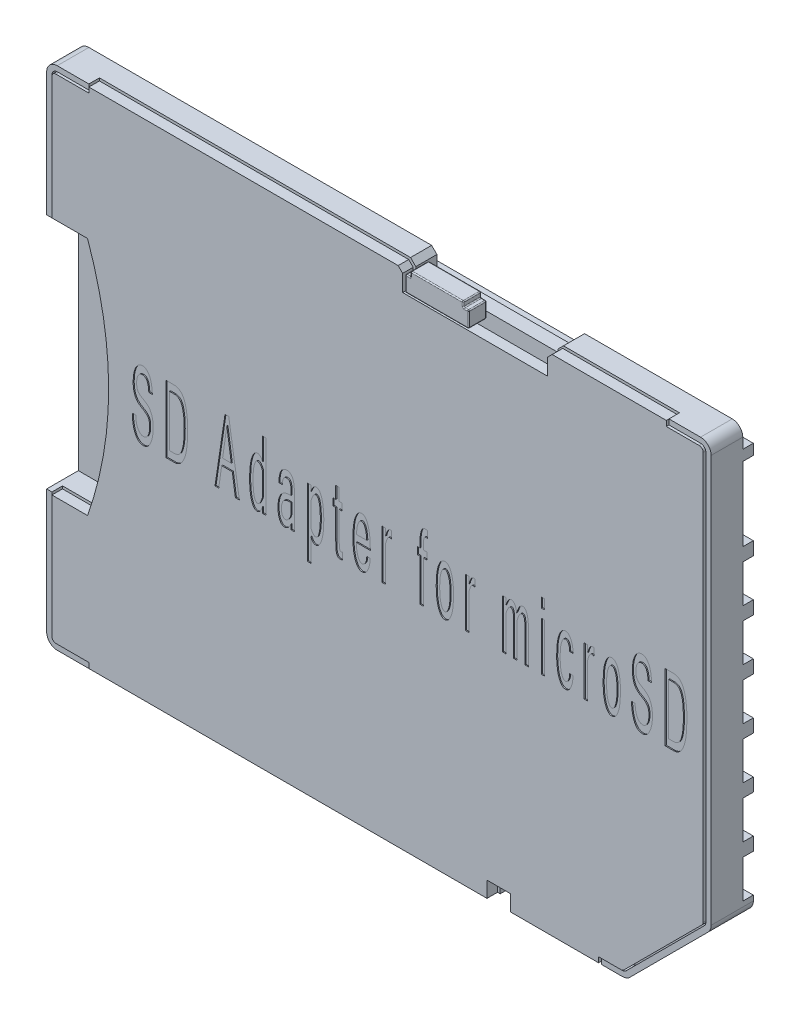
from build123d import *

# Parameters (mm, degrees)
BOSS_EXTRUDE1_DEPTH   = 2
FILLET1_R             = 0.5
CUT_EXTRUDE1_START    = -0.5
CUT_EXTRUDE1_DEPTH    = 0.5
CUT_EXTRUDE2_START    = -0.5
CUT_EXTRUDE2_DEPTH    = 0.5
SKETCH4_W             = 6.75
SKETCH4_H             = 0.75
CUT_EXTRUDE3_DEPTH    = 1.5
CHAMFER1_SIZE         = 0.25
SKETCH5_W             = 5.75
SKETCH5_H             = 3.5
CUT_EXTRUDE4_DEPTH    = 0.5
SKETCH9_W             = 5.75
SKETCH9_H             = 1.8
CUT_EXTRUDE7_DEPTH    = 0.5
SKETCH10_W            = 4
SKETCH10_H            = 3.25
BOSS_EXTRUDE2_DEPTH   = 0.05
SKETCH10_H_2          = 1.55
BOSS_EXTRUDE2_2_DEPTH = 0.05
BOSS_EXTRUDE2_3_DEPTH = 0.05
BOSS_EXTRUDE2_4_DEPTH = 0.05
BOSS_EXTRUDE2_5_DEPTH = 0.05
BOSS_EXTRUDE2_6_DEPTH = 0.05
BOSS_EXTRUDE2_7_DEPTH = 0.05
SKETCH10_W_2          = 3.75
BOSS_EXTRUDE2_8_DEPTH = 0.05
SKETCH11_W            = 6.75
SKETCH11_H            = 0.75
CUT_EXTRUDE8_DEPTH    = 0.25
CUT_EXTRUDE9_DEPTH    = 1.5
CUT_EXTRUDE11_DEPTH   = 0.5
CUT_EXTRUDE12_DEPTH   = 1
BOSS_EXTRUDE3_DEPTH   = 0.5
SKETCH19_W            = 0.164935065
SKETCH19_H            = 2.309090909
SKETCH19_H_2          = 0.453571428
CUT_EXTRUDE13_DEPTH   = 0.05
SKETCH20_W            = 6.75
SKETCH20_H            = 0.35
CUT_EXTRUDE14_DEPTH   = 1
BOSS_EXTRUDE4_DEPTH   = 1
SKETCH23_W            = 0.25
SKETCH23_H            = 0.25
CUT_EXTRUDE15_DEPTH   = 1
FILLET3_R             = 0.05


with BuildPart() as part:
    # Sketch1 → Boss-Extrude1 (new body)
    with BuildSketch(Plane.XY):
        Polygon((6.25, 0), (6.25, 0.75), (5.25, 0.75), (5.25, 0), (-15.75, 0), (-15.75, 24), (15.75, 24), (15.75, 4), (11.75, 0), align=None)
    extrude(amount=BOSS_EXTRUDE1_DEPTH)

    # Fillet1
    fillet1_edges = [part.edges().sort_by_distance(p)[0] for p in [
        (-15.75, 0, 1),
        (-15.75, 24, 1),
        (15.75, 24, 1),
        (11.75, 0, 1),
        (15.75, 4, 1),
    ]]
    fillet(fillet1_edges, radius=FILLET1_R)

    # Sketch2 → Cut-Extrude1 (cut)
    with BuildSketch(Plane(origin=(0, 0, 0), x_dir=(-1, 0, 0), z_dir=(0, 0, -1)).offset(CUT_EXTRUDE1_START)):
        with BuildLine():
            Line((15.75, 23), (15.75, 23.5))
            ThreePointArc((15.75, 23.5), (15.603553391, 23.853553391), (15.25, 24))
            Line((15.25, 24), (-15.25, 24))
            ThreePointArc((-15.25, 24), (-15.603553391, 23.853553391), (-15.75, 23.5))
            Line((-15.75, 23.5), (-15.75, 23))
            Line((-15.75, 23), (0, 23))
            Line((0, 23), (15.75, 23))
        make_face()
    extrude(amount=CUT_EXTRUDE1_DEPTH, mode=Mode.SUBTRACT)

    # Sketch3 → Cut-Extrude2 (cut)
    with BuildSketch(Plane(origin=(0, 0, 0), x_dir=(-1, 0, 0), z_dir=(0, 0, -1)).offset(CUT_EXTRUDE2_START)):
        with BuildLine():
            Line((0, 0.75), (15.75, 0.75))
            Line((15.75, 0.75), (15.75, 0.5))
            ThreePointArc((15.75, 0.5), (15.603553391, 0.146446609), (15.25, 0))
            Line((15.25, 0), (-5.25, 0))
            Line((-5.25, 0), (-6.25, 0))
            Line((-6.25, 0), (-11.542893219, 0))
            ThreePointArc((-11.542893219, 0), (-11.734234935, 0.038060234), (-11.896446609, 0.146446609))
            Line((-11.896446609, 0.146446609), (-12.5, 0.75))
            Line((-12.5, 0.75), (0, 0.75))
        make_face()
    extrude(amount=CUT_EXTRUDE2_DEPTH, mode=Mode.SUBTRACT)

    # Sketch4 → Cut-Extrude3 (cut)
    with BuildSketch(Plane.XY.offset(2)):
        with Locations((4.625, 23.625)):
            Rectangle(SKETCH4_W, SKETCH4_H)
    extrude(amount=-CUT_EXTRUDE3_DEPTH, mode=Mode.SUBTRACT)

    # Chamfer1
    chamfer1_edges = [part.edges().sort_by_distance(p)[0] for p in [
        (8, 24, 1.25),
        (1.25, 24, 1.25),
    ]]
    chamfer(chamfer1_edges, length=CHAMFER1_SIZE)

    # Sketch5 → Cut-Extrude4 (cut)
    with BuildSketch(Plane(origin=(0, 0, 0), x_dir=(-1, 0, 0), z_dir=(0, 0, -1))):
        with Locations((-12.875, 20.75)):
            Rectangle(SKETCH5_W, SKETCH5_H)
    extrude(amount=-CUT_EXTRUDE4_DEPTH, mode=Mode.SUBTRACT)

    # Sketch9 → Cut-Extrude7 (cut)
    with BuildSketch(Plane(origin=(0, 0, 0), x_dir=(-1, 0, 0), z_dir=(0, 0, -1))):
        with Locations((-12.875, 17.475)):
            Rectangle(SKETCH9_W, SKETCH9_H)
        with Locations((-12.875, 5.35)):
            Rectangle(SKETCH9_W, SKETCH9_H)
        with Locations((-12.875, 15.05)):
            Rectangle(SKETCH9_W, SKETCH9_H)
        with Locations((-12.875, 7.775)):
            Rectangle(SKETCH9_W, SKETCH9_H)
        with Locations((-12.875, 12.625)):
            Rectangle(SKETCH9_W, SKETCH9_H)
        with Locations((-12.875, 10.2)):
            Rectangle(SKETCH9_W, SKETCH9_H)
        Polygon((-15.6, 3.85), (-7.75, 3.85), (-7.75, 2.05), (-13.8, 2.05), align=None)
    extrude(amount=-CUT_EXTRUDE7_DEPTH, mode=Mode.SUBTRACT)

    # Sketch11 → Cut-Extrude8 (cut)
    with BuildSketch(Plane(origin=(0, 23.25, 0), x_dir=(1, 0, 0), z_dir=(0, 1, 0))):
        with Locations((4.625, -1.525)):
            Rectangle(SKETCH11_W, SKETCH11_H)
    extrude(amount=-CUT_EXTRUDE8_DEPTH, mode=Mode.SUBTRACT)

    # Sketch12 → Cut-Extrude9 (cut)
    with BuildSketch(Plane.XY.offset(2)):
        with BuildLine():
            Line((-15.75, 6.375), (-15.75, 17.625))
            Line((-15.75, 17.625), (-13.75, 17.625))
            add(Edge.make_bspline(
                [(-13.75, 6.375), (-12.25, 12), (-13.75, 17.625)],
                knots=[0, 0, 0, 1, 1, 1], degree=2))
            Line((-13.75, 6.375), (-15.75, 6.375))
        make_face()
    extrude(amount=-CUT_EXTRUDE9_DEPTH, mode=Mode.SUBTRACT)

    # Sketch13 → Cut-Extrude11 (cut)
    with BuildSketch(Plane.XY.offset(2)):
        with BuildLine():
            Line((-15.5, 23.5), (-15.5, 17.625))
            Line((-15.5, 17.625), (-13.75, 17.625))
            add(Edge.make_bspline(
                [(-13.75, 6.375), (-12.25, 12), (-13.75, 17.625)],
                knots=[0, 0, 0, 1, 1, 1], degree=2))
            Line((-13.75, 6.375), (-15.5, 6.375))
            Line((-15.5, 6.375), (-15.5, 0.5))
            ThreePointArc((-15.5, 0.5), (-15.426776695, 0.323223305), (-15.25, 0.25))
            Line((-15.25, 0.25), (-13.75, 0.25))
            Line((-13.75, 0.25), (-13.75, 0))
            Line((-13.75, 0), (5.25, 0))
            Line((5.25, 0), (5.25, 0.75))
            Line((5.25, 0.75), (6.25, 0.75))
            Line((6.25, 0.75), (6.25, 0))
            Line((6.25, 0), (10.542893219, 0))
            Line((10.542893219, 0), (10.542893219, 0.25))
            Line((10.542893219, 0.25), (11.542893219, 0.25))
            ThreePointArc((11.542893219, 0.25), (11.638564077, 0.269030117), (11.719669914, 0.323223305))
            Line((11.719669914, 0.323223305), (15.426776695, 4.030330086))
            ThreePointArc((15.426776695, 4.030330086), (15.480969883, 4.111435923), (15.5, 4.207106781))
            Line((15.5, 4.207106781), (15.5, 23.5))
            ThreePointArc((15.5, 23.5), (15.426776695, 23.676776695), (15.25, 23.75))
            Line((15.25, 23.75), (13.75, 23.75))
            Line((13.75, 23.75), (13.75, 24))
            Line((13.75, 24), (8.25, 24))
            Line((8.25, 24), (8, 23.75))
            Line((8, 23.75), (8, 23.25))
            Line((8, 23.25), (1.25, 23.25))
            Line((1.25, 23.25), (1.25, 23.75))
            Line((1.25, 23.75), (1, 24))
            Line((1, 24), (-13.75, 24))
            Line((-13.75, 24), (-13.75, 23.75))
            Line((-13.75, 23.75), (-15.25, 23.75))
            ThreePointArc((-15.25, 23.75), (-15.426776695, 23.676776695), (-15.5, 23.5))
        make_face()
    extrude(amount=-CUT_EXTRUDE11_DEPTH, mode=Mode.SUBTRACT)

    # Sketch14 → Cut-Extrude12 (cut)
    with BuildSketch(Plane.XY.offset(1.5)):
        with BuildLine():
            Line((-13.75, 17.625), (-3.75, 17.625))
            Line((-3.75, 17.625), (-3.75, 6.374999968))
            Line((-3.75, 6.374999968), (-13.750000009, 6.374999968))
            add(Edge.make_bspline(
                [(-13.750000009, 6.374999968), (-12.249999996, 11.999999984), (-13.75, 17.625)],
                knots=[0, 0, 0, 1, 1, 1], degree=2))
        make_face()
    extrude(amount=-CUT_EXTRUDE12_DEPTH, mode=Mode.SUBTRACT)

    # Sketch20 → Cut-Extrude14 (cut)
    with BuildSketch(Plane(origin=(0, 23, 0), x_dir=(1, 0, 0), z_dir=(0, 1, 0))):
        with Locations((4.625, -1.325)):
            Rectangle(SKETCH20_W, SKETCH20_H)
    extrude(amount=-CUT_EXTRUDE14_DEPTH, mode=Mode.SUBTRACT)


with BuildPart() as body_2:
    # Sketch10 → Boss-Extrude2 (new body)
    with BuildSketch(Plane(origin=(0, 0, 0.5), x_dir=(-1, 0, 0), z_dir=(0, 0, -1))):
        with Locations((-12.125, 20.75)):
            Rectangle(SKETCH10_W, SKETCH10_H)
    extrude(amount=BOSS_EXTRUDE2_DEPTH)


with BuildPart() as body_3:
    # Sketch10 → Boss-Extrude2 2 (new body)
    with BuildSketch(Plane(origin=(0, 0, 0.5), x_dir=(-1, 0, 0), z_dir=(0, 0, -1))):
        with Locations((-12.125, 17.475)):
            Rectangle(SKETCH10_W, SKETCH10_H_2)
    extrude(amount=BOSS_EXTRUDE2_2_DEPTH)


with BuildPart() as body_4:
    # Sketch10 → Boss-Extrude2 3 (new body)
    with BuildSketch(Plane(origin=(0, 0, 0.5), x_dir=(-1, 0, 0), z_dir=(0, 0, -1))):
        with Locations((-12.125, 15.05)):
            Rectangle(SKETCH10_W, SKETCH10_H_2)
    extrude(amount=BOSS_EXTRUDE2_3_DEPTH)


with BuildPart() as body_5:
    # Sketch10 → Boss-Extrude2 4 (new body)
    with BuildSketch(Plane(origin=(0, 0, 0.5), x_dir=(-1, 0, 0), z_dir=(0, 0, -1))):
        with Locations((-12.125, 12.625)):
            Rectangle(SKETCH10_W, SKETCH10_H_2)
    extrude(amount=BOSS_EXTRUDE2_4_DEPTH)


with BuildPart() as body_6:
    # Sketch10 → Boss-Extrude2 5 (new body)
    with BuildSketch(Plane(origin=(0, 0, 0.5), x_dir=(-1, 0, 0), z_dir=(0, 0, -1))):
        with Locations((-12.125, 10.2)):
            Rectangle(SKETCH10_W, SKETCH10_H_2)
    extrude(amount=BOSS_EXTRUDE2_5_DEPTH)


with BuildPart() as body_7:
    # Sketch10 → Boss-Extrude2 6 (new body)
    with BuildSketch(Plane(origin=(0, 0, 0.5), x_dir=(-1, 0, 0), z_dir=(0, 0, -1))):
        with Locations((-12.125, 7.775)):
            Rectangle(SKETCH10_W, SKETCH10_H_2)
    extrude(amount=BOSS_EXTRUDE2_6_DEPTH)


with BuildPart() as body_8:
    # Sketch10 → Boss-Extrude2 7 (new body)
    with BuildSketch(Plane(origin=(0, 0, 0.5), x_dir=(-1, 0, 0), z_dir=(0, 0, -1))):
        with Locations((-12.125, 5.35)):
            Rectangle(SKETCH10_W, SKETCH10_H_2)
    extrude(amount=BOSS_EXTRUDE2_7_DEPTH)


with BuildPart() as body_9:
    # Sketch10 → Boss-Extrude2 8 (new body)
    with BuildSketch(Plane(origin=(0, 0, 0.5), x_dir=(-1, 0, 0), z_dir=(0, 0, -1))):
        with Locations((-9.75, 2.95)):
            Rectangle(SKETCH10_W_2, SKETCH10_H_2)
    extrude(amount=BOSS_EXTRUDE2_8_DEPTH)


with BuildPart() as body_10:
    # Sketch16 → Boss-Extrude3 (new body)
    with BuildSketch(Plane.XY.offset(1.5625)):
        with BuildLine():
            Line((-15.4375, 17.6875), (-13.75, 17.6875))
            add(Edge.make_bspline(
                [(-13.75, 6.312499995), (-11.75, 11.999999998), (-13.75, 17.6875)],
                knots=[0, 0, 0, 1, 1, 1], degree=2))
            Line((-13.75, 6.312499995), (-15.4375, 6.3125))
            Line((-15.4375, 6.3125), (-15.4375, 0.5))
            ThreePointArc((-15.4375, 0.5), (-15.382582521, 0.367417479), (-15.25, 0.3125))
            Line((-15.25, 0.3125), (-13.6875, 0.3125))
            Line((-13.6875, 0.3125), (-13.6875, 0.0625))
            Line((-13.6875, 0.0625), (5.1875, 0.0625))
            Line((5.1875, 0.0625), (5.1875, 0.8125))
            Line((5.1875, 0.8125), (6.3125, 0.8125))
            Line((6.3125, 0.8125), (6.3125, 0.0625))
            Line((6.3125, 0.0625), (10.480393219, 0.0625))
            Line((10.480393219, 0.0625), (10.480393219, 0.3125))
            Line((10.480393219, 0.3125), (11.542893219, 0.3125))
            ThreePointArc((11.542893219, 0.3125), (11.614646362, 0.326772588), (11.67547574, 0.367417479))
            Line((11.67547574, 0.367417479), (15.382582521, 4.07452426))
            ThreePointArc((15.382582521, 4.07452426), (15.423227412, 4.135353638), (15.4375, 4.207106781))
            Line((15.4375, 4.207106781), (15.4375, 23.5))
            ThreePointArc((15.4375, 23.5), (15.382582521, 23.632582521), (15.25, 23.6875))
            Line((15.25, 23.6875), (13.6875, 23.6875))
            Line((13.6875, 23.6875), (13.6875, 23.9375))
            Line((13.6875, 23.9375), (8.275888348, 23.9375))
            Line((8.275888348, 23.9375), (8.0625, 23.724111652))
            Line((8.0625, 23.724111652), (8.0625, 22.9375))
            Line((8.0625, 22.9375), (1.1875, 22.9375))
            Line((1.1875, 22.9375), (1.1875, 23.724111652))
            Line((1.1875, 23.724111652), (0.974111652, 23.9375))
            Line((0.974111652, 23.9375), (-13.6875, 23.9375))
            Line((-13.6875, 23.9375), (-13.6875, 23.6875))
            Line((-13.6875, 23.6875), (-15.25, 23.6875))
            ThreePointArc((-15.25, 23.6875), (-15.382582521, 23.632582521), (-15.4375, 23.5))
            Line((-15.4375, 23.5), (-15.4375, 17.6875))
        make_face()
    extrude(amount=BOSS_EXTRUDE3_DEPTH)

    # Sketch19 → Cut-Extrude13 (cut)
    # profile 1 of 20: a face of its own
    with BuildSketch(Plane.XY.offset(2.0625)):
        with BuildLine():
            add(Edge.make_bspline(
                [(-11.099461331, 10.508844186), (-11.120809065, 10.50960525), (-11.162503622, 10.511091694), (-11.222866631, 10.525892933), (-11.278854701, 10.549837045), (-11.330426936, 10.583695102), (-11.378666174, 10.625568099), (-11.421262405, 10.678372712), (-11.459747278, 10.739976521), (-11.49439623, 10.810170226), (-11.523712806, 10.888034944), (-11.551208276, 10.971017049), (-11.573519188, 11.059804149), (-11.591915933, 11.153852002), (-11.607460742, 11.253112895), (-11.619124453, 11.357568289), (-11.625914147, 11.467449941), (-11.627992391, 11.54247225), (-11.629057516, 11.580922108)],
                knots=[0, 0, 0, 0, 0.777745722, 1.519026098, 2.25268717, 2.989563779, 3.761404643, 4.574132064, 5.454643921, 6.407892909, 7.425123631, 8.488256209, 9.596331727, 10.762805543, 11.98418652, 13.261504269, 14.596487168, 16, 16, 16, 16], degree=3))
            Line((-11.629057516, 11.580922108), (-11.464122452, 11.580922108))
            add(Edge.make_bspline(
                [(-11.464122452, 11.580922108), (-11.462808381, 11.552134076), (-11.460255682, 11.496210739), (-11.453451344, 11.415333717), (-11.44304144, 11.340333929), (-11.430220602, 11.271081774), (-11.415000303, 11.207559557), (-11.397174479, 11.14966909), (-11.375801497, 11.098043507), (-11.352231112, 11.051861497), (-11.325385746, 11.012176595), (-11.298516692, 10.976673462), (-11.269631202, 10.947124001), (-11.239333046, 10.922754584), (-11.208270965, 10.903062223), (-11.174899948, 10.89026551), (-11.140961068, 10.881247875), (-11.117559403, 10.880380221), (-11.105904107, 10.879948082)],
                knots=[0, 0, 0, 0, 1.608744714, 3.125130981, 4.529046492, 5.83410932, 7.05542091, 8.174021277, 9.211555631, 10.17144147, 11.062603576, 11.882791738, 12.654304626, 13.362074318, 14.050906347, 14.696545069, 15.350808906, 16, 16, 16, 16], degree=3))
            add(Edge.make_bspline(
                [(-11.105904107, 10.879948082), (-11.094927734, 10.880548506), (-11.073221011, 10.881735897), (-11.041131102, 10.88805764), (-11.011112751, 10.899842515), (-10.982482021, 10.915580657), (-10.956120538, 10.936613862), (-10.931123438, 10.961735447), (-10.907471425, 10.991129109), (-10.878880145, 11.038010458), (-10.848289354, 11.10615239), (-10.82201196, 11.199392479), (-10.807035165, 11.305547393), (-10.805295481, 11.380502973), (-10.804382192, 11.419852709)],
                knots=[0, 0, 0, 0, 0.578696431, 1.144421974, 1.71375521, 2.270818851, 2.859164542, 3.483084025, 4.134987626, 4.841256163, 6.3700847, 8.052912389, 9.927881344, 12, 12, 12, 12], degree=3))
            add(Edge.make_bspline(
                [(-10.804382192, 11.419852709), (-10.80462276, 11.440903844), (-10.805084702, 11.481326536), (-10.808785417, 11.539867387), (-10.815906579, 11.593848323), (-10.825428313, 11.643594085), (-10.837555713, 11.68888267), (-10.852360598, 11.729650598), (-10.869521633, 11.766262221), (-10.898333383, 11.80965358), (-10.944349778, 11.860489002), (-11.012015612, 11.918958011), (-11.095070332, 11.977379793), (-11.192232816, 12.030315115), (-11.290308737, 12.089924821), (-11.374738434, 12.165700882), (-11.444456255, 12.252257917), (-11.489769164, 12.333499132), (-11.518559352, 12.404206207), (-11.537224658, 12.461715536), (-11.552669861, 12.523538746), (-11.565204951, 12.58939869), (-11.57588496, 12.65963003), (-11.582448659, 12.734082963), (-11.587328559, 12.812716109), (-11.587656149, 12.866462255), (-11.58782375, 12.893959852)],
                knots=[0, 0, 0, 0, 0.851188691, 1.634464688, 2.370130918, 3.051352022, 3.681211254, 4.263608179, 4.803471842, 5.311677663, 6.363850697, 7.563880196, 8.922664537, 10.459720023, 12.037519631, 13.550494171, 15.020596078, 16.513501092, 17.292384356, 18.105235409, 18.956113973, 19.867250135, 20.815335571, 21.827174204, 22.888339113, 24, 24, 24, 24], degree=3))
            add(Edge.make_bspline(
                [(-11.58782375, 12.893959852), (-11.587480174, 12.925110384), (-11.58680662, 12.986178589), (-11.580747434, 13.075367593), (-11.571906857, 13.16053522), (-11.559262076, 13.241242784), (-11.542387581, 13.317812276), (-11.52199068, 13.389987352), (-11.497383748, 13.457695528), (-11.469943158, 13.520690125), (-11.439653328, 13.578095659), (-11.405110696, 13.627737527), (-11.369507052, 13.670732903), (-11.330691939, 13.705685691), (-11.289612892, 13.733137751), (-11.245402004, 13.751914079), (-11.199133103, 13.76422964), (-11.167189677, 13.765611508), (-11.151003539, 13.766311718)],
                knots=[0, 0, 0, 0, 1.399452284, 2.743517712, 4.014778034, 5.245814736, 6.411747719, 7.535718646, 8.613207963, 9.645866622, 10.621594736, 11.523587764, 12.358798455, 13.12408219, 13.862744548, 14.567211728, 15.273988102, 16, 16, 16, 16], degree=3))
            add(Edge.make_bspline(
                [(-11.151003539, 13.766311718), (-11.133968298, 13.765596193), (-11.100348869, 13.764184086), (-11.051364678, 13.752079774), (-11.005018579, 13.732557336), (-10.961442843, 13.704979322), (-10.920340342, 13.669689591), (-10.882686061, 13.626047894), (-10.846955626, 13.575397883), (-10.814505949, 13.517098798), (-10.783984166, 13.452368308), (-10.758687969, 13.380260115), (-10.736207027, 13.302160329), (-10.716676561, 13.217732405), (-10.702259306, 13.126844741), (-10.691510508, 13.029648708), (-10.683540345, 12.926077449), (-10.681652322, 12.854673829), (-10.680680893, 12.817935095)],
                knots=[0, 0, 0, 0, 0.704337287, 1.390025367, 2.075252248, 2.778241735, 3.515902335, 4.309561026, 5.158037816, 6.077675582, 7.068029688, 8.116943568, 9.236738095, 10.431483893, 11.70154939, 13.04359492, 14.4788645, 16, 16, 16, 16], degree=3))
            Line((-10.680680893, 12.817935095), (-10.845615958, 12.817935095))
            add(Edge.make_bspline(
                [(-10.845615958, 12.817935095), (-10.846756221, 12.841351967), (-10.84895564, 12.886520088), (-10.854565522, 12.952124586), (-10.863155525, 13.012865376), (-10.872644432, 13.069459851), (-10.88407075, 13.121331446), (-10.897498278, 13.16901904), (-10.913612639, 13.211720686), (-10.930933261, 13.250565218), (-10.950760624, 13.284359379), (-10.972308645, 13.3141657), (-10.995854648, 13.339186738), (-11.021717248, 13.359687116), (-11.049270904, 13.376161539), (-11.079386519, 13.386639719), (-11.11086216, 13.394596255), (-11.132694258, 13.39500019), (-11.143916486, 13.395207822)],
                knots=[0, 0, 0, 0, 1.572189747, 3.03255096, 4.413487559, 5.684944598, 6.879959889, 7.973939925, 9.003856036, 9.938319956, 10.822604766, 11.626280387, 12.400511128, 13.11801191, 13.834355431, 14.540638882, 15.249852983, 16, 16, 16, 16], degree=3))
            add(Edge.make_bspline(
                [(-11.143916486, 13.395207822), (-11.165004397, 13.393649446), (-11.206351508, 13.390593935), (-11.26431743, 13.364501316), (-11.313322591, 13.320989078), (-11.353272953, 13.262228663), (-11.384319943, 13.190322005), (-11.407313409, 13.107555141), (-11.420600219, 13.013790986), (-11.422100379, 12.947908295), (-11.422888685, 12.913288179)],
                knots=[0, 0, 0, 0, 0.815861592, 1.599661493, 2.415267502, 3.331097186, 4.334968509, 5.443428959, 6.656569986, 8, 8, 8, 8], degree=3))
            add(Edge.make_bspline(
                [(-11.422888685, 12.913288179), (-11.422176679, 12.882331571), (-11.420841463, 12.824279043), (-11.410433917, 12.743292248), (-11.392088904, 12.674321045), (-11.365113105, 12.615274324), (-11.325601533, 12.564001946), (-11.27473853, 12.516063418), (-11.211152618, 12.468732351), (-11.137275287, 12.424221493), (-11.060504603, 12.38144565), (-10.990691402, 12.335399241), (-10.929549672, 12.289602797), (-10.874099163, 12.243705293), (-10.825189426, 12.190335443), (-10.782340088, 12.125409862), (-10.742358942, 12.048819642), (-10.706194305, 11.959269491), (-10.675644008, 11.855265677), (-10.654364237, 11.735209362), (-10.641867752, 11.599013288), (-10.640282493, 11.502778427), (-10.639447127, 11.452066589)],
                knots=[0, 0, 0, 0, 1.048737635, 1.966684141, 2.759331229, 3.459170909, 4.150446626, 4.937832464, 5.821211264, 6.830875334, 7.858008757, 8.798491728, 9.661496114, 10.446018783, 11.234076796, 12.10392568, 13.073870369, 14.157568856, 15.371014655, 16.739728777, 18.281970344, 20, 20, 20, 20], degree=3))
            add(Edge.make_bspline(
                [(-10.639447127, 11.452066589), (-10.639828469, 11.418987748), (-10.640576904, 11.35406617), (-10.646141357, 11.258770119), (-10.656855835, 11.1679308), (-10.669770681, 11.081306392), (-10.68821409, 10.999254316), (-10.709603567, 10.92112698), (-10.736539582, 10.847623082), (-10.765525198, 10.778469125), (-10.797753981, 10.715642246), (-10.833528482, 10.660902243), (-10.871387846, 10.614085395), (-10.911922534, 10.575583343), (-10.955335227, 10.546046309), (-11.000737541, 10.524118426), (-11.049420551, 10.511693317), (-11.082644122, 10.509801694), (-11.099461331, 10.508844186)],
                knots=[0, 0, 0, 0, 1.387354246, 2.722865316, 4.00101478, 5.222695616, 6.394066922, 7.526132451, 8.6173288, 9.674654688, 10.669723579, 11.574072583, 12.412505925, 13.189937891, 13.909434297, 14.606480256, 15.294623902, 16, 16, 16, 16], degree=3))
        make_face()
    # profile 2 of 20: a face of its own
    with BuildSketch(Plane.XY.offset(2.0625)):
        with BuildLine():
            Line((-10.033310763, 13.725077952), (-9.637724318, 13.725077952))
            add(Edge.make_bspline(
                [(-9.637724318, 13.725077952), (-9.6120696, 13.723767312), (-9.561613563, 13.72118963), (-9.488248768, 13.702906202), (-9.420503551, 13.671242177), (-9.357413553, 13.627878714), (-9.299926884, 13.571622531), (-9.247766449, 13.503221291), (-9.200612359, 13.422831312), (-9.158177396, 13.330522873), (-9.122028903, 13.225397589), (-9.090045566, 13.108500816), (-9.062226339, 12.979524761), (-9.040999707, 12.838071771), (-9.023755022, 12.684621718), (-9.010722419, 12.518969854), (-9.004067353, 12.341010587), (-9.003011774, 12.218332202), (-9.002466607, 12.154973447)],
                knots=[0, 0, 0, 0, 0.664117479, 1.306143178, 1.943139374, 2.591015305, 3.279282035, 4.016767483, 4.812196642, 5.688066411, 6.643123639, 7.687404295, 8.825064228, 10.057561132, 11.389620866, 12.823175158, 14.359289881, 16, 16, 16, 16], degree=3))
            add(Edge.make_bspline(
                [(-9.002466607, 12.154973447), (-9.003009275, 12.090111355), (-9.004059012, 11.964641929), (-9.010737481, 11.78260696), (-9.023725155, 11.613301211), (-9.041030863, 11.456425293), (-9.062168482, 11.311957429), (-9.090087162, 11.180212059), (-9.121950974, 11.060928041), (-9.158160977, 10.953674631), (-9.200842516, 10.859377126), (-9.247425604, 10.776745686), (-9.299716447, 10.706814229), (-9.357613358, 10.649993891), (-9.420245131, 10.605121565), (-9.488225963, 10.57299652), (-9.561516654, 10.553788503), (-9.612054802, 10.551327801), (-9.637724318, 10.550077952)],
                knots=[0, 0, 0, 0, 1.651070993, 3.193836683, 4.635714943, 5.972284005, 7.210837606, 8.350537625, 9.398152402, 10.352453548, 11.22834556, 12.029129462, 12.762760285, 13.44313227, 14.086247447, 14.71472122, 15.347176614, 16, 16, 16, 16], degree=3))
            Line((-9.637724318, 10.550077952), (-10.033310763, 10.550077952))
            Line((-10.033310763, 10.550077952), (-10.033310763, 13.725077952))
        make_face()
        with BuildLine():
            Line((-9.868375698, 10.921181848), (-9.639657151, 10.921181848))
            add(Edge.make_bspline(
                [(-9.639657151, 10.921181848), (-9.617663811, 10.922149739), (-9.575076819, 10.924023922), (-9.513842184, 10.939204548), (-9.458087201, 10.964710312), (-9.407725485, 11.000734165), (-9.36364636, 11.047372568), (-9.325354701, 11.10386977), (-9.292782511, 11.17014362), (-9.26524234, 11.246089315), (-9.242970191, 11.331326127), (-9.221985279, 11.424474171), (-9.205788008, 11.526336842), (-9.191549072, 11.636099061), (-9.18068496, 11.754302794), (-9.173378756, 11.880442759), (-9.167696636, 12.014899614), (-9.167502082, 12.107290226), (-9.167401672, 12.154973447)],
                knots=[0, 0, 0, 0, 0.726034289, 1.405862686, 2.069498799, 2.74097994, 3.438611636, 4.178693632, 4.98793943, 5.87249034, 6.843398602, 7.897105259, 9.026381008, 10.249830955, 11.554025083, 12.947482775, 14.424581748, 16, 16, 16, 16], degree=3))
            add(Edge.make_bspline(
                [(-9.167401672, 12.154973447), (-9.167512969, 12.201367517), (-9.167728942, 12.291395396), (-9.173270563, 12.422212507), (-9.180983987, 12.545079904), (-9.190659717, 12.659932419), (-9.205001801, 12.766724266), (-9.22229936, 12.865150083), (-9.242141541, 12.955748161), (-9.26475541, 13.038280685), (-9.292058171, 13.112191559), (-9.324935797, 13.176566564), (-9.362759821, 13.231765787), (-9.407559448, 13.27637792), (-9.457439059, 13.311794927), (-9.513450486, 13.336757854), (-9.57496429, 13.350886942), (-9.617679496, 13.352925292), (-9.639657151, 13.353974056)],
                knots=[0, 0, 0, 0, 1.567080064, 3.040925148, 4.422062527, 5.725829304, 6.933446378, 8.060564571, 9.100822261, 10.06545045, 10.949362225, 11.757275384, 12.501968447, 13.199626688, 13.881914695, 14.557380425, 15.257749198, 16, 16, 16, 16], degree=3))
            Line((-9.639657151, 13.353974056), (-9.868375698, 13.353974056))
            Line((-9.868375698, 13.353974056), (-9.868375698, 10.921181848))
        make_face(mode=Mode.SUBTRACT)
    # profile 3 of 20: a face of its own
    with BuildSketch(Plane.XY.offset(2.0625)):
        Polygon((-6.553180893, 10.550077952), (-6.742598507, 10.550077952), (-6.888205244, 11.539688342), (-7.392030325, 11.539688342), (-7.530550008, 10.550077952), (-7.707726348, 10.550077952), (-7.233538036, 13.725077952), (-7.057005974, 13.725077952), align=None)
        Polygon((-6.937170341, 11.869558472), (-7.147204838, 13.293411962), (-7.346286616, 11.869558472), align=None, mode=Mode.SUBTRACT)
    # profile 4 of 20: a face of its own
    with BuildSketch(Plane.XY.offset(2.0625)):
        with BuildLine():
            add(Edge.make_bspline(
                [(-5.452239335, 10.826473042), (-5.460921228, 10.801435405), (-5.477291532, 10.754225232), (-5.50549079, 10.689469296), (-5.535357977, 10.634784657), (-5.565656593, 10.589007713), (-5.598612677, 10.553733141), (-5.632827285, 10.528046143), (-5.668933515, 10.512163975), (-5.693919393, 10.509931265), (-5.706084708, 10.508844186)],
                knots=[0, 0, 0, 0, 1.47718162, 2.785326886, 3.932050067, 4.948330166, 5.837691124, 6.608853696, 7.322668056, 8, 8, 8, 8], degree=3))
            add(Edge.make_bspline(
                [(-5.706084708, 10.508844186), (-5.720398758, 10.509838439), (-5.748748889, 10.511807637), (-5.789626178, 10.5278614), (-5.827367027, 10.553639777), (-5.862287715, 10.589526323), (-5.895470265, 10.634352725), (-5.924575183, 10.690147593), (-5.952192642, 10.755189765), (-5.976803659, 10.829877734), (-5.999213434, 10.91266596), (-6.018436312, 11.003017721), (-6.034145551, 11.10026602), (-6.047916504, 11.20421766), (-6.057823027, 11.315152402), (-6.065686249, 11.433072783), (-6.070174173, 11.557907534), (-6.070552149, 11.643413569), (-6.070745828, 11.687227912)],
                knots=[0, 0, 0, 0, 0.521673143, 1.033215747, 1.581643758, 2.180877282, 2.854141062, 3.612516102, 4.473868501, 5.434152648, 6.482972767, 7.606449997, 8.807431764, 10.081452575, 11.436912724, 12.875943719, 14.399195183, 16, 16, 16, 16], degree=3))
            add(Edge.make_bspline(
                [(-6.070745828, 11.687227912), (-6.070270414, 11.73275914), (-6.069346265, 11.821266356), (-6.06520319, 11.950419229), (-6.056717194, 12.072236891), (-6.045238149, 12.186771712), (-6.03080869, 12.294131439), (-6.01171972, 12.393929851), (-5.991173228, 12.486880695), (-5.965940564, 12.571739908), (-5.938566769, 12.647876621), (-5.909918474, 12.714706755), (-5.879212823, 12.771308346), (-5.846209272, 12.8176968), (-5.811795093, 12.854566898), (-5.774714806, 12.880520925), (-5.736010486, 12.897347421), (-5.709031666, 12.899396072), (-5.695776266, 12.900402628)],
                knots=[0, 0, 0, 0, 1.624594962, 3.158016646, 4.609635135, 5.980501217, 7.264613429, 8.4728966, 9.604887377, 10.659548814, 11.629079208, 12.490343017, 13.251703498, 13.921540722, 14.517635369, 15.040535657, 15.528590094, 16, 16, 16, 16], degree=3))
            add(Edge.make_bspline(
                [(-5.695776266, 12.900402628), (-5.683890768, 12.899579901), (-5.6603175, 12.897948134), (-5.625577195, 12.887039142), (-5.592674996, 12.868701124), (-5.561188402, 12.842855229), (-5.531960032, 12.80955636), (-5.503242873, 12.769784064), (-5.476392857, 12.722551541), (-5.460553157, 12.687925503), (-5.452239335, 12.669751248)],
                knots=[0, 0, 0, 0, 0.803416158, 1.593466476, 2.438333255, 3.33643309, 4.333769869, 5.425969402, 6.648962136, 8, 8, 8, 8], degree=3))
            Line((-5.452239335, 12.669751248), (-5.452239335, 13.725077952))
            Line((-5.452239335, 13.725077952), (-5.28730427, 13.725077952))
            Line((-5.28730427, 13.725077952), (-5.28730427, 10.550077952))
            Line((-5.28730427, 10.550077952), (-5.452239335, 10.550077952))
            Line((-5.452239335, 10.550077952), (-5.452239335, 10.826473042))
        make_face()
        with BuildLine():
            Line((-5.452239335, 11.225280874), (-5.452239335, 12.296714519))
            add(Edge.make_bspline(
                [(-5.452239335, 12.296714519), (-5.460484494, 12.318336288), (-5.476056513, 12.359171711), (-5.503347014, 12.414804819), (-5.530910356, 12.462123054), (-5.558873474, 12.501479948), (-5.588800699, 12.531668331), (-5.619358281, 12.553564977), (-5.651244208, 12.567748239), (-5.673309453, 12.569613587), (-5.68417927, 12.570532498)],
                knots=[0, 0, 0, 0, 1.466577539, 2.76981565, 3.923475456, 4.936626219, 5.822453119, 6.604443409, 7.3125186, 8, 8, 8, 8], degree=3))
            add(Edge.make_bspline(
                [(-5.68417927, 12.570532498), (-5.692462287, 12.569975472), (-5.709545048, 12.568826672), (-5.733595491, 12.556830876), (-5.755907491, 12.538823138), (-5.776848567, 12.514025169), (-5.796505289, 12.482570201), (-5.814238636, 12.443779176), (-5.831865459, 12.398786344), (-5.846734977, 12.346439672), (-5.861146268, 12.287636903), (-5.87313733, 12.221783266), (-5.883314925, 12.149125036), (-5.891573717, 12.069824075), (-5.89805124, 11.983670368), (-5.902140799, 11.89063113), (-5.905851044, 11.790770375), (-5.905824465, 11.722022925), (-5.905810763, 11.686583634)],
                knots=[0, 0, 0, 0, 0.412125604, 0.849961095, 1.316807884, 1.842813097, 2.466285958, 3.168514079, 3.97525544, 4.88365423, 5.890341692, 7.005985902, 8.233163914, 9.563116099, 10.997265734, 12.558227217, 14.225767137, 16, 16, 16, 16], degree=3))
            add(Edge.make_bspline(
                [(-5.905810763, 11.686583634), (-5.905851305, 11.6528608), (-5.905929828, 11.587545463), (-5.901874957, 11.492867683), (-5.89896615, 11.404497427), (-5.891850583, 11.32251323), (-5.884980756, 11.246512938), (-5.873919085, 11.177093137), (-5.863808137, 11.113409353), (-5.849891782, 11.05638588), (-5.835742695, 11.005308096), (-5.818710958, 10.961634164), (-5.801752315, 10.924017642), (-5.782193115, 10.893874754), (-5.762571158, 10.868909757), (-5.740076651, 10.851904675), (-5.716341293, 10.840432205), (-5.699547733, 10.839281676), (-5.691266323, 10.838714316)],
                knots=[0, 0, 0, 0, 1.756662639, 3.402353721, 4.936675931, 6.362039923, 7.689116802, 8.910685879, 10.023554527, 11.04669434, 11.967301265, 12.781851433, 13.487538718, 14.111403205, 14.651482917, 15.130380491, 15.57116443, 16, 16, 16, 16], degree=3))
            add(Edge.make_bspline(
                [(-5.691266323, 10.838714316), (-5.680279847, 10.839871411), (-5.656793582, 10.842344982), (-5.624422884, 10.863478426), (-5.592655645, 10.894112471), (-5.56319397, 10.937645038), (-5.53319864, 10.992215299), (-5.506099627, 11.059545568), (-5.476914763, 11.137803584), (-5.460821695, 11.194855401), (-5.452239335, 11.225280874)],
                knots=[0, 0, 0, 0, 0.548721702, 1.173026069, 1.89110018, 2.76623608, 3.80064, 5.020323887, 6.410952316, 8, 8, 8, 8], degree=3))
        make_face(mode=Mode.SUBTRACT)
    # profile 5 of 20: a face of its own
    with BuildSketch(Plane.XY.offset(2.0625)):
        with BuildLine():
            add(Edge.make_bspline(
                [(-4.103895179, 10.787172108), (-4.114073007, 10.76531057), (-4.13351811, 10.723543328), (-4.166795319, 10.666384335), (-4.203125627, 10.618346848), (-4.240982376, 10.578412371), (-4.281600651, 10.547360984), (-4.32444907, 10.525049147), (-4.370035035, 10.511498012), (-4.401247283, 10.509734846), (-4.417014091, 10.508844186)],
                knots=[0, 0, 0, 0, 1.302760767, 2.488970589, 3.565924069, 4.550777251, 5.453657745, 6.31524554, 7.148949497, 8, 8, 8, 8], degree=3))
            add(Edge.make_bspline(
                [(-4.417014091, 10.508844186), (-4.428044609, 10.509197902), (-4.44985625, 10.509897337), (-4.48128992, 10.519864758), (-4.511474942, 10.534017485), (-4.539768171, 10.554347403), (-4.566794767, 10.580023589), (-4.591474909, 10.611889551), (-4.615486883, 10.648906169), (-4.646163049, 10.706976469), (-4.677022705, 10.790842079), (-4.703918159, 10.902365915), (-4.719950042, 11.02702673), (-4.721558718, 11.114416253), (-4.722401672, 11.160208837)],
                knots=[0, 0, 0, 0, 0.505517224, 0.999604989, 1.503477621, 2.03535111, 2.594522264, 3.21337582, 3.88489908, 4.623126389, 6.230788065, 7.980389052, 9.893702059, 12, 12, 12, 12], degree=3))
            add(Edge.make_bspline(
                [(-4.722401672, 11.160208837), (-4.722103481, 11.192219083), (-4.721526448, 11.254162347), (-4.715031673, 11.344084297), (-4.704152283, 11.427745958), (-4.689483708, 11.505248665), (-4.670931653, 11.576636902), (-4.648010575, 11.641921862), (-4.619998184, 11.700851029), (-4.588721161, 11.754199155), (-4.552404788, 11.800835119), (-4.511993404, 11.841365232), (-4.467338782, 11.875930776), (-4.417838995, 11.903511979), (-4.364750544, 11.925709795), (-4.307358214, 11.941161803), (-4.245706977, 11.9501481), (-4.203144493, 11.951387327), (-4.181208491, 11.952026004)],
                knots=[0, 0, 0, 0, 1.410778108, 2.73000722, 3.971115686, 5.127759905, 6.204642483, 7.219667387, 8.172439759, 9.076715476, 9.940183175, 10.770208072, 11.59383848, 12.420455525, 13.260781023, 14.124248721, 15.033268731, 16, 16, 16, 16], degree=3))
            Line((-4.181208491, 11.952026004), (-4.103895179, 11.952026004))
            add(Edge.make_bspline(
                [(-4.103895179, 11.952026004), (-4.103967327, 11.990469589), (-4.104100751, 12.061563855), (-4.106305368, 12.159708257), (-4.108319879, 12.24093485), (-4.112584576, 12.307421555), (-4.119769969, 12.363213394), (-4.130055777, 12.412566788), (-4.146743832, 12.456619272), (-4.16592044, 12.49616761), (-4.190987996, 12.529676762), (-4.224057028, 12.55382218), (-4.263823839, 12.568417199), (-4.292541203, 12.569808439), (-4.3074869, 12.570532498)],
                knots=[0, 0, 0, 0, 1.922531684, 3.555365017, 4.909316106, 5.985967535, 6.885201509, 7.721630545, 8.499760231, 9.234662186, 9.91571491, 10.568752865, 11.255120133, 12, 12, 12, 12], degree=3))
            add(Edge.make_bspline(
                [(-4.3074869, 12.570532498), (-4.32356935, 12.569547062), (-4.354637627, 12.567643386), (-4.397855765, 12.548959406), (-4.434435756, 12.518853889), (-4.463523717, 12.476435527), (-4.486615572, 12.42331851), (-4.502570238, 12.358645588), (-4.513576891, 12.282902074), (-4.515308901, 12.22846697), (-4.516232841, 12.199428602)],
                knots=[0, 0, 0, 0, 0.80928671, 1.563390058, 2.334875791, 3.175381329, 4.137681552, 5.248903171, 6.532429341, 8, 8, 8, 8], degree=3))
            Line((-4.516232841, 12.199428602), (-4.681167906, 12.199428602))
            add(Edge.make_bspline(
                [(-4.681167906, 12.199428602), (-4.680366484, 12.227790676), (-4.678816356, 12.282649245), (-4.672120216, 12.36215569), (-4.663251084, 12.436104723), (-4.651975262, 12.504825669), (-4.636899015, 12.567694796), (-4.620551862, 12.625630398), (-4.600613426, 12.677761385), (-4.577988151, 12.724548843), (-4.553058595, 12.766003306), (-4.52507076, 12.802041827), (-4.494180846, 12.832541821), (-4.460178523, 12.857239189), (-4.423913842, 12.877001041), (-4.384664372, 12.890330945), (-4.342894229, 12.899245042), (-4.313978711, 12.900009545), (-4.299111291, 12.900402628)],
                knots=[0, 0, 0, 0, 1.534979133, 2.968991504, 4.31519168, 5.564576203, 6.734307813, 7.811741792, 8.819563873, 9.749840995, 10.620743253, 11.432003073, 12.212641403, 12.961046227, 13.699278086, 14.437967083, 15.1968534, 16, 16, 16, 16], degree=3))
            add(Edge.make_bspline(
                [(-4.299111291, 12.900402628), (-4.285318733, 12.8999826), (-4.2581111, 12.899154039), (-4.218666709, 12.890341588), (-4.181369581, 12.876933003), (-4.146763543, 12.857283257), (-4.115115308, 12.831579609), (-4.085289806, 12.801249986), (-4.05813074, 12.765139379), (-4.032536859, 12.72335003), (-4.009502278, 12.673176155), (-3.990742397, 12.61292731), (-3.975056091, 12.542388772), (-3.961455325, 12.461552548), (-3.951706129, 12.370095571), (-3.943875571, 12.268052545), (-3.939498089, 12.155441348), (-3.939144547, 12.076804661), (-3.938960114, 12.035782092)],
                knots=[0, 0, 0, 0, 0.637995616, 1.25853013, 1.862902114, 2.468828072, 3.091909685, 3.746220648, 4.434735892, 5.180400196, 6.012875157, 6.985107553, 8.097736496, 9.35882342, 10.780559583, 12.357071294, 14.099585582, 16, 16, 16, 16], degree=3))
            Line((-3.938960114, 12.035782092), (-3.938960114, 10.550077952))
            Line((-3.938960114, 10.550077952), (-4.103895179, 10.550077952))
            Line((-4.103895179, 10.550077952), (-4.103895179, 10.787172108))
        make_face()
        with BuildLine():
            Line((-4.103895179, 11.167940168), (-4.103895179, 11.663389641))
            Line((-4.103895179, 11.663389641), (-4.212133815, 11.663389641))
            add(Edge.make_bspline(
                [(-4.212133815, 11.663389641), (-4.239401112, 11.662368668), (-4.291143955, 11.660431255), (-4.363140112, 11.636536996), (-4.424854982, 11.599646632), (-4.474763197, 11.546132135), (-4.513071318, 11.478159809), (-4.53818686, 11.395269715), (-4.555513437, 11.299015209), (-4.556787903, 11.229882808), (-4.557466607, 11.193066994)],
                knots=[0, 0, 0, 0, 0.981719057, 1.862925292, 2.709577278, 3.55508995, 4.476437416, 5.504910911, 6.671263662, 8, 8, 8, 8], degree=3))
            add(Edge.make_bspline(
                [(-4.557466607, 11.193066994), (-4.556964325, 11.16618216), (-4.556020279, 11.115651715), (-4.546102038, 11.044663273), (-4.531475284, 10.983062528), (-4.509813271, 10.931424777), (-4.482213616, 10.890401297), (-4.449173198, 10.861038951), (-4.411560859, 10.841791646), (-4.384376934, 10.839748054), (-4.370626104, 10.838714316)],
                knots=[0, 0, 0, 0, 1.456806804, 2.738089984, 3.879135648, 4.880685565, 5.759334491, 6.534939417, 7.258907699, 8, 8, 8, 8], degree=3))
            add(Edge.make_bspline(
                [(-4.370626104, 10.838714316), (-4.357584181, 10.839971867), (-4.330768001, 10.842557584), (-4.29140221, 10.860233686), (-4.253346186, 10.888575479), (-4.216987675, 10.927862871), (-4.182403114, 10.976015159), (-4.151818998, 11.032852742), (-4.125237658, 11.097529622), (-4.111227255, 11.143751063), (-4.103895179, 11.167940168)],
                knots=[0, 0, 0, 0, 0.695402601, 1.429853683, 2.266644695, 3.215209453, 4.274482112, 5.423411175, 6.651591607, 8, 8, 8, 8], degree=3))
        make_face(mode=Mode.SUBTRACT)
    # profile 6 of 20: a face of its own
    with BuildSketch(Plane.XY.offset(2.0625)):
        with BuildLine():
            add(Edge.make_bspline(
                [(-3.167888685, 12.582773772), (-3.159214444, 12.6078171), (-3.14285857, 12.655038007), (-3.114564454, 12.719723385), (-3.084937221, 12.774737577), (-3.053710877, 12.819796217), (-3.021539082, 12.855727873), (-2.987268021, 12.881171624), (-2.951201947, 12.897089446), (-2.926211064, 12.899317712), (-2.914043312, 12.900402628)],
                knots=[0, 0, 0, 0, 1.477432653, 2.785800226, 3.932718282, 4.955991344, 5.83732366, 6.608617283, 7.32255295, 8, 8, 8, 8], degree=3))
            add(Edge.make_bspline(
                [(-2.914043312, 12.900402628), (-2.899724522, 12.899417345), (-2.871365004, 12.897465914), (-2.830670685, 12.88132216), (-2.792585297, 12.856120326), (-2.756936997, 12.820690633), (-2.725000093, 12.774697229), (-2.6956063, 12.719323574), (-2.667806799, 12.654531951), (-2.643337554, 12.580009362), (-2.620996881, 12.497422007), (-2.601680714, 12.407523739), (-2.585927219, 12.31070737), (-2.572219587, 12.206960865), (-2.562302627, 12.096027573), (-2.554442459, 11.978106767), (-2.549953661, 11.853272139), (-2.549575808, 11.767766086), (-2.549382192, 11.723951735)],
                knots=[0, 0, 0, 0, 0.522314817, 1.034486632, 1.579244411, 2.184795776, 2.860625161, 3.619933023, 4.475121934, 5.436587259, 6.486697456, 7.603875844, 8.798584696, 10.07417259, 11.431299995, 12.872101039, 14.397226147, 16, 16, 16, 16], degree=3))
            add(Edge.make_bspline(
                [(-2.549382192, 11.723951735), (-2.549861484, 11.67820623), (-2.550793295, 11.589270544), (-2.554877908, 11.459681581), (-2.563504756, 11.33766893), (-2.574596167, 11.22282756), (-2.590495128, 11.115279619), (-2.60784691, 11.014686449), (-2.629852482, 10.92182447), (-2.654799543, 10.836863726), (-2.682044711, 10.760864138), (-2.711029456, 10.694410693), (-2.741500298, 10.637889331), (-2.774616665, 10.59180361), (-2.808342902, 10.554486419), (-2.845439147, 10.528752144), (-2.884310894, 10.511803563), (-2.911519156, 10.509824474), (-2.924996031, 10.508844186)],
                knots=[0, 0, 0, 0, 1.629490708, 3.167958738, 4.617117417, 5.985660526, 7.276240159, 8.488620904, 9.62042675, 10.673301032, 11.641188527, 12.493988753, 13.254059086, 13.922761252, 14.51256176, 15.034575978, 15.521803393, 16, 16, 16, 16], degree=3))
            add(Edge.make_bspline(
                [(-2.924996031, 10.508844186), (-2.936889976, 10.509635891), (-2.960749533, 10.511224073), (-2.995424137, 10.52272755), (-3.028211116, 10.541354311), (-3.059571592, 10.567037447), (-3.089029083, 10.600398494), (-3.117270675, 10.64071107), (-3.144653169, 10.687960903), (-3.159877971, 10.722994859), (-3.167888685, 10.741428399)],
                knots=[0, 0, 0, 0, 0.800980918, 1.606788244, 2.436432822, 3.331810421, 4.326124167, 5.426787311, 6.646073023, 8, 8, 8, 8], degree=3))
            Line((-3.167888685, 10.741428399), (-3.167888685, 9.642935095))
            Line((-3.167888685, 9.642935095), (-3.33282375, 9.642935095))
            Line((-3.33282375, 9.642935095), (-3.33282375, 12.859168861))
            Line((-3.33282375, 12.859168861), (-3.167888685, 12.859168861))
            Line((-3.167888685, 12.859168861), (-3.167888685, 12.582773772))
        make_face()
        with BuildLine():
            add(Edge.make_bspline(
                [(-3.167888685, 11.112532295), (-3.159579862, 11.090939096), (-3.143921135, 11.050244762), (-3.117474374, 10.99433569), (-3.089976743, 10.946861199), (-3.061176722, 10.908202303), (-3.031974293, 10.877385876), (-3.001250784, 10.855519642), (-2.969055259, 10.841598403), (-2.946809517, 10.839660456), (-2.93594875, 10.838714316)],
                knots=[0, 0, 0, 0, 1.465623702, 2.762100214, 3.915009699, 4.935607783, 5.811289133, 6.59277083, 7.312965726, 8, 8, 8, 8], degree=3))
            add(Edge.make_bspline(
                [(-2.93594875, 10.838714316), (-2.927658959, 10.83926237), (-2.910562229, 10.840392668), (-2.88674421, 10.852476189), (-2.863792977, 10.869922398), (-2.842980682, 10.894754753), (-2.823362071, 10.926452393), (-2.806200487, 10.965173104), (-2.788089342, 11.009959311), (-2.773333677, 11.06236997), (-2.759063173, 11.121413546), (-2.747044768, 11.187255451), (-2.736707113, 11.259893903), (-2.728609548, 11.339214128), (-2.722064935, 11.425575116), (-2.717990734, 11.518616078), (-2.714276006, 11.618476329), (-2.714303225, 11.687223852), (-2.714317257, 11.722663179)],
                knots=[0, 0, 0, 0, 0.412024127, 0.84975181, 1.309875385, 1.850915349, 2.459411736, 3.171193772, 3.967716041, 4.875891159, 5.892782942, 7.008152449, 8.224385315, 9.564701042, 10.998497549, 12.559074679, 14.226204003, 16, 16, 16, 16], degree=3))
            add(Edge.make_bspline(
                [(-2.714317257, 11.722663179), (-2.714382544, 11.756382265), (-2.71450898, 11.82168377), (-2.717133035, 11.916415834), (-2.721457713, 12.004722824), (-2.72811289, 12.086751902), (-2.735495034, 12.162651115), (-2.745099794, 12.232300697), (-2.756600653, 12.295742902), (-2.770070691, 12.352915959), (-2.784714359, 12.403721883), (-2.800354503, 12.447997788), (-2.818728036, 12.48478425), (-2.837086239, 12.515832907), (-2.857621909, 12.540096583), (-2.880137008, 12.557570294), (-2.904280852, 12.568699059), (-2.921240206, 12.569931716), (-2.929505974, 12.570532498)],
                knots=[0, 0, 0, 0, 1.75523097, 3.399238753, 4.932840319, 6.357042647, 7.683037967, 8.902023285, 10.015950194, 11.038256155, 11.958112791, 12.768073771, 13.478043648, 14.095456593, 14.64234304, 15.120850316, 15.571513929, 16, 16, 16, 16], degree=3))
            add(Edge.make_bspline(
                [(-2.929505974, 12.570532498), (-2.940479184, 12.569360055), (-2.963642132, 12.566885187), (-2.996200687, 12.546328345), (-3.027206184, 12.515059224), (-3.057012082, 12.471677013), (-3.086735169, 12.417149506), (-3.114343819, 12.350046302), (-3.143037561, 12.27159046), (-3.159264387, 12.214375027), (-3.167888685, 12.183965939)],
                knots=[0, 0, 0, 0, 0.549203548, 1.15929375, 1.885520094, 2.761424472, 3.796736727, 5.007543007, 6.409556934, 8, 8, 8, 8], degree=3))
            Line((-3.167888685, 12.183965939), (-3.167888685, 11.112532295))
        make_face(mode=Mode.SUBTRACT)
    # profile 7 of 20: a face of its own
    with BuildSketch(Plane.XY.offset(2.0625)):
        with BuildLine():
            add(Edge.make_bspline(
                [(-1.654609465, 10.535903845), (-1.672825667, 10.52817135), (-1.709900663, 10.512433591), (-1.750120808, 10.5100544), (-1.770579432, 10.508844186)],
                knots=[0, 0, 0, 0, 0.982667776, 2, 2, 2, 2], degree=3))
            add(Edge.make_bspline(
                [(-1.770579432, 10.508844186), (-1.786226877, 10.509855146), (-1.816173874, 10.511789982), (-1.857783772, 10.529772849), (-1.892258973, 10.559140268), (-1.918389247, 10.599934251), (-1.938198945, 10.648770096), (-1.954892186, 10.70399489), (-1.966999775, 10.765714728), (-1.974514741, 10.834687518), (-1.978226577, 10.913217509), (-1.982572326, 11.00317724), (-1.984074484, 11.105870543), (-1.984339341, 11.178463829), (-1.984479594, 11.216905266)],
                knots=[0, 0, 0, 0, 0.695022102, 1.330174088, 1.982640888, 2.686647467, 3.467695233, 4.328272767, 5.256255088, 6.268548879, 7.41992793, 8.762154834, 10.285414148, 12, 12, 12, 12], degree=3))
            Line((-1.984479594, 11.216905266), (-1.984479594, 12.529298731))
            Line((-1.984479594, 12.529298731), (-2.108180893, 12.529298731))
            Line((-2.108180893, 12.529298731), (-2.108180893, 12.859168861))
            Line((-2.108180893, 12.859168861), (-1.984479594, 12.859168861))
            Line((-1.984479594, 12.859168861), (-1.984479594, 13.436441589))
            Line((-1.984479594, 13.436441589), (-1.819544529, 13.436441589))
            Line((-1.819544529, 13.436441589), (-1.819544529, 12.859168861))
            Line((-1.819544529, 12.859168861), (-1.695843231, 12.859168861))
            Line((-1.695843231, 12.859168861), (-1.695843231, 12.529298731))
            Line((-1.695843231, 12.529298731), (-1.819544529, 12.529298731))
            Line((-1.819544529, 12.529298731), (-1.819544529, 11.202731158))
            add(Edge.make_bspline(
                [(-1.819544529, 11.202731158), (-1.819299159, 11.183833162), (-1.818833508, 11.147969656), (-1.81864119, 11.096833756), (-1.816537271, 11.051302351), (-1.814058396, 11.011125559), (-1.810885849, 10.976313218), (-1.80720467, 10.946834665), (-1.802770338, 10.92271472), (-1.796496513, 10.898748291), (-1.785732701, 10.875985681), (-1.771129875, 10.855240208), (-1.753552636, 10.840838575), (-1.739874994, 10.839410208), (-1.733211331, 10.838714316)],
                knots=[0, 0, 0, 0, 1.710549871, 3.246181015, 4.627426013, 5.835013716, 6.889091212, 7.790758186, 8.522677395, 9.107399239, 10.02916327, 10.779434276, 11.405347904, 12, 12, 12, 12], degree=3))
            add(Edge.make_bspline(
                [(-1.733211331, 10.838714316), (-1.719520786, 10.839494658), (-1.69237512, 10.841041925), (-1.667125021, 10.851116306), (-1.654609465, 10.856109811)],
                knots=[0, 0, 0, 0, 1.008672636, 2, 2, 2, 2], degree=3))
            Line((-1.654609465, 10.856109811), (-1.654609465, 10.535903845))
        make_face()
    # profile 8 of 20: a face of its own
    with BuildSketch(Plane.XY.offset(2.0625)):
        with BuildLine():
            add(Edge.make_bspline(
                [(-0.734065633, 10.508844186), (-0.750291671, 10.509856056), (-0.782573146, 10.511869157), (-0.829284867, 10.527605562), (-0.873461248, 10.552744208), (-0.914484893, 10.588263253), (-0.953909609, 10.632836081), (-0.989240852, 10.688043458), (-1.022910116, 10.75256439), (-1.054140926, 10.826451195), (-1.082313053, 10.909078381), (-1.105801272, 11.000093657), (-1.126514565, 11.098519231), (-1.142714811, 11.204832291), (-1.156755813, 11.318643799), (-1.164999324, 11.440377316), (-1.171222439, 11.569905009), (-1.1718511, 11.658871066), (-1.1721744, 11.704623407)],
                knots=[0, 0, 0, 0, 0.567758104, 1.129546769, 1.709352561, 2.339680168, 3.022312613, 3.788519783, 4.630277726, 5.571233659, 6.597200124, 7.687219542, 8.863832895, 10.121180212, 11.455401086, 12.881978692, 14.396503374, 16, 16, 16, 16], degree=3))
            add(Edge.make_bspline(
                [(-1.1721744, 11.704623407), (-1.171755922, 11.749941385), (-1.170940507, 11.838244798), (-1.166000108, 11.966971115), (-1.156856648, 12.088136073), (-1.144969097, 12.20167181), (-1.128924653, 12.307678932), (-1.109020193, 12.406132602), (-1.085965056, 12.497143157), (-1.059848174, 12.580326426), (-1.030495738, 12.654581609), (-0.999158404, 12.719764022), (-0.965008803, 12.774850788), (-0.929154814, 12.820528422), (-0.890849257, 12.856529346), (-0.849498944, 12.881397548), (-0.805856899, 12.89739766), (-0.775646697, 12.899398297), (-0.760481015, 12.900402628)],
                knots=[0, 0, 0, 0, 1.608184465, 3.133594744, 4.570301806, 5.919383421, 7.183658624, 8.373358125, 9.482384139, 10.513947609, 11.464950226, 12.313618308, 13.077008478, 13.760179566, 14.369713222, 14.930410604, 15.463060442, 16, 16, 16, 16], degree=3))
            add(Edge.make_bspline(
                [(-0.760481015, 12.900402628), (-0.745126428, 12.899347195), (-0.714345236, 12.897231379), (-0.669592569, 12.881899316), (-0.628300005, 12.855355062), (-0.58873769, 12.820494879), (-0.552598376, 12.774712092), (-0.518459623, 12.719618609), (-0.487283445, 12.654203136), (-0.458582908, 12.579359566), (-0.432329082, 12.49566441), (-0.409174359, 12.403412155), (-0.390091683, 12.302926268), (-0.374802658, 12.194102221), (-0.362788107, 12.077182104), (-0.353691284, 11.952147174), (-0.348705729, 11.818916065), (-0.347909923, 11.727391808), (-0.347499075, 11.680140858)],
                knots=[0, 0, 0, 0, 0.534070575, 1.070646087, 1.624489443, 2.233446526, 2.89769696, 3.646448668, 4.485561796, 5.415598916, 6.434507731, 7.536758686, 8.724196943, 9.992716075, 11.360526563, 12.814412809, 14.355386566, 16, 16, 16, 16], degree=3))
            Line((-0.347499075, 11.680140858), (-0.347499075, 11.580922108))
            Line((-0.347499075, 11.580922108), (-1.007239335, 11.580922108))
            add(Edge.make_bspline(
                [(-1.007239335, 11.580922108), (-1.006037563, 11.550423143), (-1.0037176, 11.491546328), (-0.998945393, 11.406200853), (-0.991144973, 11.327138458), (-0.981481718, 11.254083596), (-0.970303238, 11.186873903), (-0.955817376, 11.125978749), (-0.94100023, 11.070781152), (-0.922641235, 11.022340169), (-0.903284235, 10.979509638), (-0.883153259, 10.942075029), (-0.860888493, 10.910655515), (-0.837898623, 10.88476626), (-0.813948173, 10.864281049), (-0.788688571, 10.849643756), (-0.76225145, 10.839942151), (-0.74380888, 10.839119959), (-0.734709911, 10.838714316)],
                knots=[0, 0, 0, 0, 1.732653052, 3.344805085, 4.851405557, 6.241061709, 7.527765316, 8.716550399, 9.793290932, 10.769248776, 11.653068321, 12.46061797, 13.177708476, 13.833755851, 14.422211699, 14.957502079, 15.485665183, 16, 16, 16, 16], degree=3))
            add(Edge.make_bspline(
                [(-0.734709911, 10.838714316), (-0.720680052, 10.839867673), (-0.69192217, 10.842231783), (-0.652265445, 10.865708584), (-0.614631788, 10.899584638), (-0.580491471, 10.947045053), (-0.550819309, 11.006645376), (-0.529426617, 11.078293306), (-0.51613561, 11.161022557), (-0.513716678, 11.219857294), (-0.51243414, 11.251051978)],
                knots=[0, 0, 0, 0, 0.654257919, 1.341073535, 2.113592556, 3.03071343, 4.069614234, 5.232501182, 6.532648314, 8, 8, 8, 8], degree=3))
            Line((-0.51243414, 11.251051978), (-0.347499075, 11.251051978))
            add(Edge.make_bspline(
                [(-0.347499075, 11.251051978), (-0.349151501, 11.222251361), (-0.352363749, 11.166264161), (-0.361701212, 11.084846547), (-0.373033229, 11.008504832), (-0.387117831, 10.937035352), (-0.404365498, 10.870989124), (-0.424471002, 10.809908164), (-0.446856422, 10.753857944), (-0.471710631, 10.702803184), (-0.499527816, 10.657786513), (-0.52846576, 10.618216973), (-0.55858452, 10.584379877), (-0.590598904, 10.556797641), (-0.624112328, 10.535194146), (-0.659470977, 10.520302176), (-0.696197119, 10.510739771), (-0.721336163, 10.509481385), (-0.734065633, 10.508844186)],
                knots=[0, 0, 0, 0, 1.523184645, 2.961007433, 4.325998, 5.598269373, 6.805912535, 7.928491641, 8.992055646, 9.991266677, 10.922996753, 11.782709193, 12.577666458, 13.309610539, 14.008103159, 14.6737824, 15.328453088, 16, 16, 16, 16], degree=3))
        make_face()
        with BuildLine():
            add(Edge.make_bspline(
                [(-0.51243414, 11.910792238), (-0.513979446, 11.937435042), (-0.516986215, 11.989275096), (-0.524190908, 12.064230641), (-0.532556153, 12.134048027), (-0.541925252, 12.198599804), (-0.553616181, 12.257875549), (-0.566456373, 12.312045986), (-0.580265698, 12.361287121), (-0.596635621, 12.40494695), (-0.61309777, 12.443919827), (-0.630932448, 12.477408507), (-0.649951858, 12.505500453), (-0.669045182, 12.529162319), (-0.68986902, 12.547645916), (-0.711973886, 12.560677585), (-0.734990035, 12.569025588), (-0.750751322, 12.570033767), (-0.758548182, 12.570532498)],
                knots=[0, 0, 0, 0, 1.71139239, 3.329929971, 4.828142349, 6.22084245, 7.511975424, 8.701241137, 9.790956604, 10.788804245, 11.689430901, 12.502849666, 13.217184927, 13.862604477, 14.448236966, 14.991525757, 15.501123707, 16, 16, 16, 16], degree=3))
            add(Edge.make_bspline(
                [(-0.758548182, 12.570532498), (-0.766347145, 12.570050573), (-0.781909323, 12.569088933), (-0.804540729, 12.560704313), (-0.825808004, 12.547398655), (-0.84698191, 12.529867254), (-0.866021567, 12.506013936), (-0.884525794, 12.477627436), (-0.90282101, 12.444328082), (-0.919809041, 12.405903051), (-0.936290166, 12.362395549), (-0.949934868, 12.313321584), (-0.96303894, 12.259243872), (-0.973632798, 12.199800308), (-0.983382094, 12.135142785), (-0.991540164, 12.065079), (-0.998865403, 11.989708746), (-1.00183931, 11.937650957), (-1.003373669, 11.910792238)],
                knots=[0, 0, 0, 0, 0.499405531, 0.996521949, 1.528549079, 2.105816952, 2.751921202, 3.47848603, 4.280654831, 5.187807167, 6.173784185, 7.264655688, 8.455183046, 9.745109337, 11.139286898, 12.652778285, 14.273032909, 16, 16, 16, 16], degree=3))
            Line((-1.003373669, 11.910792238), (-0.51243414, 11.910792238))
        make_face(mode=Mode.SUBTRACT)
    # profile 9 of 20: a face of its own
    with BuildSketch(Plane.XY.offset(2.0625)):
        with BuildLine():
            add(Edge.make_bspline(
                [(0.670974951, 12.544117116), (0.65842936, 12.551877079), (0.630538284, 12.569128855), (0.597606423, 12.570034318), (0.579487532, 12.570532498)],
                knots=[0, 0, 0, 0, 0.899613291, 2, 2, 2, 2], degree=3))
            add(Edge.make_bspline(
                [(0.579487532, 12.570532498), (0.56980686, 12.569527386), (0.549545873, 12.567423756), (0.521655347, 12.548843877), (0.49517927, 12.521861266), (0.470085788, 12.484096231), (0.446709981, 12.435776584), (0.42371474, 12.377172197), (0.402096449, 12.30794178), (0.389195141, 12.258120561), (0.382338587, 12.231642481)],
                knots=[0, 0, 0, 0, 0.558262236, 1.168404808, 1.892210689, 2.754359915, 3.787145052, 5.008770291, 6.410275377, 8, 8, 8, 8], degree=3))
            Line((0.382338587, 12.231642481), (0.382338587, 10.550077952))
            Line((0.382338587, 10.550077952), (0.217403522, 10.550077952))
            Line((0.217403522, 10.550077952), (0.217403522, 12.859168861))
            Line((0.217403522, 12.859168861), (0.382338587, 12.859168861))
            Line((0.382338587, 12.859168861), (0.382338587, 12.537030063))
            add(Edge.make_bspline(
                [(0.382338587, 12.537030063), (0.390225305, 12.565461013), (0.405084232, 12.619026192), (0.430070209, 12.693070246), (0.455371482, 12.756082651), (0.482333632, 12.807628012), (0.510326281, 12.848189256), (0.539347987, 12.877594153), (0.570239316, 12.896627643), (0.592155059, 12.899177765), (0.602681526, 12.900402628)],
                knots=[0, 0, 0, 0, 1.583805001, 2.983959276, 4.193756857, 5.225376123, 6.101978604, 6.827651993, 7.436903319, 8, 8, 8, 8], degree=3))
            add(Edge.make_bspline(
                [(0.602681526, 12.900402628), (0.613737451, 12.899841248), (0.637213445, 12.898649224), (0.659293441, 12.890526095), (0.670974951, 12.88622852)],
                knots=[0, 0, 0, 0, 0.941891998, 2, 2, 2, 2], degree=3))
            Line((0.670974951, 12.88622852), (0.670974951, 12.544117116))
        make_face()
    # profile 10 of 20: a face of its own
    with BuildSketch(Plane.XY.offset(2.0625)):
        with BuildLine():
            Line((2.171884042, 12.529298731), (2.171884042, 10.550077952))
            Line((2.171884042, 10.550077952), (2.006948977, 10.550077952))
            Line((2.006948977, 10.550077952), (2.006948977, 12.529298731))
            Line((2.006948977, 12.529298731), (1.883247678, 12.529298731))
            Line((1.883247678, 12.529298731), (1.883247678, 12.859168861))
            Line((1.883247678, 12.859168861), (2.006948977, 12.859168861))
            Line((2.006948977, 12.859168861), (2.006948977, 13.057606361))
            add(Edge.make_bspline(
                [(2.006948977, 13.057606361), (2.007316944, 13.08616893), (2.008030882, 13.141586724), (2.010074792, 13.221979206), (2.015702875, 13.296688439), (2.021589801, 13.365977494), (2.030711666, 13.429581124), (2.041583098, 13.487861879), (2.054275276, 13.540622046), (2.068949602, 13.587835182), (2.085700676, 13.629471985), (2.104386054, 13.665754089), (2.12454179, 13.696965911), (2.147619617, 13.721986128), (2.172338067, 13.74169318), (2.199210663, 13.756377481), (2.228491018, 13.764954756), (2.248714372, 13.765858341), (2.258861518, 13.766311718)],
                knots=[0, 0, 0, 0, 1.682686318, 3.264789059, 4.735714876, 6.095200488, 7.360045379, 8.518709402, 9.586446618, 10.554673438, 11.428555133, 12.226329761, 12.956113334, 13.609660163, 14.222125097, 14.810740165, 15.403284344, 16, 16, 16, 16], degree=3))
            add(Edge.make_bspline(
                [(2.258861518, 13.766311718), (2.27090517, 13.766141569), (2.293800036, 13.765818116), (2.326026293, 13.761368774), (2.354116069, 13.75397748), (2.37041315, 13.7461451), (2.378052873, 13.742473447)],
                knots=[0, 0, 0, 0, 1.176221201, 2.235985042, 3.173067544, 4, 4, 4, 4], degree=3))
            Line((2.378052873, 13.742473447), (2.378052873, 13.41453615))
            add(Edge.make_bspline(
                [(2.378052873, 13.41453615), (2.36281382, 13.42108747), (2.332757638, 13.434008722), (2.300091923, 13.435638258), (2.283988344, 13.436441589)],
                knots=[0, 0, 0, 0, 1.014037853, 2, 2, 2, 2], degree=3))
            add(Edge.make_bspline(
                [(2.283988344, 13.436441589), (2.274918454, 13.435486589), (2.256332266, 13.433529587), (2.232030493, 13.415092787), (2.212677696, 13.387351915), (2.19737525, 13.348758299), (2.185363657, 13.297860528), (2.177866829, 13.232173901), (2.172889093, 13.151319815), (2.172237042, 13.092192936), (2.171884042, 13.060183472)],
                knots=[0, 0, 0, 0, 0.510457021, 1.046038004, 1.666843379, 2.42259169, 3.391732292, 4.63610605, 6.17889182, 8, 8, 8, 8], degree=3))
            Line((2.171884042, 13.060183472), (2.171884042, 12.859168861))
            Line((2.171884042, 12.859168861), (2.336819107, 12.859168861))
            Line((2.336819107, 12.859168861), (2.336819107, 12.529298731))
            Line((2.336819107, 12.529298731), (2.171884042, 12.529298731))
        make_face()
    # profile 11 of 20: a face of its own
    with BuildSketch(Plane.XY.offset(2.0625)):
        with BuildLine():
            add(Edge.make_bspline(
                [(3.18971379, 12.900402628), (3.205053411, 12.899294432), (3.235737159, 12.897077715), (3.280548812, 12.882630584), (3.321877485, 12.856678292), (3.361437003, 12.82246819), (3.397635127, 12.777336317), (3.431395642, 12.723118849), (3.463137118, 12.659279851), (3.491589158, 12.585801207), (3.517794493, 12.503605567), (3.540955964, 12.413291613), (3.560193807, 12.314977759), (3.575339107, 12.208488672), (3.587423957, 12.093939309), (3.596526245, 11.971263817), (3.601469705, 11.840606974), (3.602279398, 11.750800506), (3.60269573, 11.704623407)],
                knots=[0, 0, 0, 0, 0.543037012, 1.08623356, 1.645412197, 2.25958156, 2.929099808, 3.683983603, 4.516729765, 5.448225735, 6.46975436, 7.568413915, 8.745947674, 10.013196117, 11.373737311, 12.821711901, 14.365773337, 16, 16, 16, 16], degree=3))
            add(Edge.make_bspline(
                [(3.60269573, 11.704623407), (3.602283916, 11.658446105), (3.601484923, 11.568853833), (3.596497008, 11.438414082), (3.58746579, 11.316162567), (3.575303699, 11.201834232), (3.560115803, 11.09535922), (3.541048716, 10.996794404), (3.517772022, 10.906294335), (3.491636975, 10.824065928), (3.462919, 10.750508074), (3.431769761, 10.686350306), (3.397457796, 10.63242937), (3.361238069, 10.587449743), (3.322092196, 10.552534374), (3.280525585, 10.526643373), (3.235742894, 10.512162397), (3.205055322, 10.509950148), (3.18971379, 10.508844186)],
                knots=[0, 0, 0, 0, 1.634461079, 3.171148518, 4.619330808, 5.972508933, 7.239939152, 8.425100272, 9.523917421, 10.545592575, 11.477222161, 12.316893558, 13.065467902, 13.735082187, 14.354351782, 14.913610629, 15.456885094, 16, 16, 16, 16], degree=3))
            add(Edge.make_bspline(
                [(3.18971379, 10.508844186), (3.174361388, 10.509920898), (3.143856366, 10.512060311), (3.099421756, 10.526841722), (3.057975547, 10.552291876), (3.019548957, 10.587925465), (2.982429583, 10.631963823), (2.949106661, 10.686611117), (2.917854193, 10.750594894), (2.888306965, 10.823929175), (2.862168061, 10.906213722), (2.839896343, 10.99690252), (2.820468881, 11.095336299), (2.805697097, 11.201889836), (2.792134838, 11.316079381), (2.784544522, 11.438455635), (2.77914149, 11.568846582), (2.778401704, 11.658443639), (2.778020406, 11.704623407)],
                knots=[0, 0, 0, 0, 0.543483821, 1.079895194, 1.639533922, 2.253549352, 2.92847957, 3.673496204, 4.513737954, 5.448820003, 6.471189139, 7.568883042, 8.754849193, 10.023140326, 11.378070577, 12.826697452, 14.364428699, 16, 16, 16, 16], degree=3))
            add(Edge.make_bspline(
                [(2.778020406, 11.704623407), (2.778406283, 11.750802961), (2.779156747, 11.840614205), (2.784516378, 11.971222235), (2.79217674, 12.094022153), (2.805660885, 12.208433409), (2.820391913, 12.315000509), (2.839987285, 12.413183942), (2.862145573, 12.503686124), (2.888354621, 12.585938167), (2.917634448, 12.65919322), (2.949477962, 12.722862199), (2.982249222, 12.777802582), (3.019344658, 12.821993714), (3.058192715, 12.856921864), (3.099398603, 12.88243166), (3.14386214, 12.897179877), (3.174363321, 12.899323697), (3.18971379, 12.900402628)],
                knots=[0, 0, 0, 0, 1.635338264, 3.180449971, 4.628870444, 5.991165305, 7.259275731, 8.437610447, 9.535147951, 10.557371419, 11.492320237, 12.325632833, 13.076999238, 13.751833292, 14.36069968, 14.92025867, 15.456593614, 16, 16, 16, 16], degree=3))
        make_face()
        with BuildLine():
            add(Edge.make_bspline(
                [(3.190358068, 10.838714316), (3.199489033, 10.839258684), (3.217720289, 10.840345592), (3.243953099, 10.851859304), (3.268436012, 10.869639787), (3.291813561, 10.893817363), (3.312968557, 10.92507514), (3.333780074, 10.962375591), (3.351725509, 11.007296822), (3.370220175, 11.058192091), (3.385844606, 11.116235085), (3.400168197, 11.180671615), (3.411395501, 11.251725421), (3.421034862, 11.329294506), (3.428821563, 11.413510131), (3.433639151, 11.504423157), (3.436955249, 11.601729563), (3.437486558, 11.668755586), (3.437760665, 11.703334852)],
                knots=[0, 0, 0, 0, 0.457851574, 0.914165007, 1.418767515, 1.977582633, 2.5992311, 3.31628673, 4.126484592, 5.033767449, 6.04488642, 7.153252042, 8.359815761, 9.668899651, 11.092884415, 12.621634735, 14.257074101, 16, 16, 16, 16], degree=3))
            add(Edge.make_bspline(
                [(3.437760665, 11.703334852), (3.437487263, 11.738128932), (3.436957217, 11.805584478), (3.433629732, 11.903533956), (3.428860085, 11.994880593), (3.420979194, 12.079515993), (3.411453156, 12.157313675), (3.400162976, 12.228574912), (3.385844143, 12.293010503), (3.370225732, 12.351059186), (3.351706982, 12.401935734), (3.333838521, 12.446916069), (3.312700923, 12.484186715), (3.292254391, 12.516020595), (3.268192202, 12.539585722), (3.243980535, 12.557413069), (3.217713694, 12.568895078), (3.199486832, 12.569986079), (3.190358068, 12.570532498)],
                knots=[0, 0, 0, 0, 1.748899353, 3.390604412, 4.925904168, 6.345950487, 7.662125897, 8.865352512, 9.970652626, 10.978975051, 11.883748553, 12.691705577, 13.40677798, 14.035572341, 14.585156501, 15.088363383, 15.543414749, 16, 16, 16, 16], degree=3))
            add(Edge.make_bspline(
                [(3.190358068, 12.570532498), (3.181228531, 12.569986587), (3.163000129, 12.568896599), (3.136745224, 12.557406739), (3.112481967, 12.539613329), (3.088556987, 12.515813214), (3.067107863, 12.484609468), (3.047241316, 12.446518105), (3.02806875, 12.402163676), (3.010004525, 12.351001061), (2.99394581, 12.293121568), (2.981053508, 12.228396802), (2.968083851, 12.157459899), (2.960089651, 12.079441801), (2.951749226, 11.994895257), (2.947118037, 11.903529614), (2.943750171, 11.805585679), (2.943225896, 11.73812934), (2.942955471, 11.703334852)],
                knots=[0, 0, 0, 0, 0.456485209, 0.911436868, 1.414533491, 1.963997231, 2.59883037, 3.308595396, 4.120617996, 5.025193252, 6.033294743, 7.136084154, 8.340837074, 9.655439979, 11.07517515, 12.610138506, 14.251483849, 16, 16, 16, 16], degree=3))
            add(Edge.make_bspline(
                [(2.942955471, 11.703334852), (2.943226605, 11.668755176), (2.943752153, 11.601728359), (2.947108548, 11.504427508), (2.951787736, 11.413495402), (2.960035648, 11.329369347), (2.968143006, 11.251579137), (2.981049137, 11.180849904), (2.993945141, 11.11612395), (3.01001017, 11.058250335), (3.028050042, 11.007068499), (3.047300359, 10.96277479), (3.06684597, 10.924651068), (3.089000782, 10.894031326), (3.112237878, 10.869611569), (3.136772663, 10.851865733), (3.162993533, 10.840344046), (3.18122633, 10.839258168), (3.190358068, 10.838714316)],
                knots=[0, 0, 0, 0, 1.742534548, 3.377606697, 4.906013756, 6.329678783, 7.637170487, 8.845258188, 9.951100142, 10.961992079, 11.869071217, 12.683341513, 13.395071183, 14.022861407, 14.581551051, 15.086040256, 15.542251231, 16, 16, 16, 16], degree=3))
        make_face(mode=Mode.SUBTRACT)
    # profile 12 of 20: a face of its own
    with BuildSketch(Plane.XY.offset(2.0625)):
        with BuildLine():
            add(Edge.make_bspline(
                [(4.621169756, 12.544117116), (4.608624165, 12.551877079), (4.580733089, 12.569128855), (4.547801228, 12.570034318), (4.529682337, 12.570532498)],
                knots=[0, 0, 0, 0, 0.899613291, 2, 2, 2, 2], degree=3))
            add(Edge.make_bspline(
                [(4.529682337, 12.570532498), (4.520001665, 12.569527386), (4.499740678, 12.567423756), (4.471850152, 12.548843877), (4.445374075, 12.521861266), (4.420280593, 12.484096231), (4.396904786, 12.435776584), (4.373909546, 12.377172197), (4.352291254, 12.30794178), (4.339389946, 12.258120561), (4.332533393, 12.231642481)],
                knots=[0, 0, 0, 0, 0.558262236, 1.168404808, 1.892210689, 2.754359915, 3.787145052, 5.008770291, 6.410275377, 8, 8, 8, 8], degree=3))
            Line((4.332533393, 12.231642481), (4.332533393, 10.550077952))
            Line((4.332533393, 10.550077952), (4.167598328, 10.550077952))
            Line((4.167598328, 10.550077952), (4.167598328, 12.859168861))
            Line((4.167598328, 12.859168861), (4.332533393, 12.859168861))
            Line((4.332533393, 12.859168861), (4.332533393, 12.537030063))
            add(Edge.make_bspline(
                [(4.332533393, 12.537030063), (4.34042011, 12.565461013), (4.355279037, 12.619026192), (4.380265015, 12.693070246), (4.405566287, 12.756082651), (4.432528437, 12.807628012), (4.460521086, 12.848189256), (4.489542792, 12.877594153), (4.520434121, 12.896627643), (4.542349864, 12.899177765), (4.552876331, 12.900402628)],
                knots=[0, 0, 0, 0, 1.583805001, 2.983959276, 4.193756857, 5.225376123, 6.101978604, 6.827651993, 7.436903319, 8, 8, 8, 8], degree=3))
            add(Edge.make_bspline(
                [(4.552876331, 12.900402628), (4.563932256, 12.899841248), (4.58740825, 12.898649224), (4.609488246, 12.890526095), (4.621169756, 12.88622852)],
                knots=[0, 0, 0, 0, 0.941891998, 2, 2, 2, 2], degree=3))
            Line((4.621169756, 12.88622852), (4.621169756, 12.544117116))
        make_face()
    # profile 13 of 20: a face of its own
    with BuildSketch(Plane.XY.offset(2.0625)):
        with BuildLine():
            Line((7.152923003, 10.550077952), (6.987987938, 10.550077952))
            Line((6.987987938, 10.550077952), (6.987987938, 12.040292035))
            add(Edge.make_bspline(
                [(6.987987938, 12.040292035), (6.987810743, 12.063271618), (6.987467919, 12.107730803), (6.986366835, 12.171745752), (6.983892893, 12.230619637), (6.979838081, 12.284077588), (6.975641222, 12.33268942), (6.969734377, 12.376051452), (6.963619693, 12.414432578), (6.953672824, 12.456240292), (6.93989163, 12.499611671), (6.915669488, 12.539556713), (6.883897217, 12.566011732), (6.859117365, 12.569038908), (6.846891144, 12.570532498)],
                knots=[0, 0, 0, 0, 1.411552725, 2.730967074, 3.932553203, 5.030305237, 6.023968027, 6.928812994, 7.718211903, 8.409351119, 9.5691538, 10.49491181, 11.257399083, 12, 12, 12, 12], degree=3))
            add(Edge.make_bspline(
                [(6.846891144, 12.570532498), (6.837015337, 12.569250291), (6.815661045, 12.566477797), (6.785483935, 12.546948459), (6.756622018, 12.517098862), (6.728249819, 12.475811487), (6.699687261, 12.42378708), (6.671468961, 12.359849433), (6.643458307, 12.284658544), (6.626091142, 12.230221115), (6.616884042, 12.201361434)],
                knots=[0, 0, 0, 0, 0.520736375, 1.125979504, 1.848110928, 2.710796732, 3.762235956, 4.981202082, 6.399602156, 8, 8, 8, 8], degree=3))
            Line((6.616884042, 12.201361434), (6.616884042, 10.550077952))
            Line((6.616884042, 10.550077952), (6.451948977, 10.550077952))
            Line((6.451948977, 10.550077952), (6.451948977, 12.040292035))
            add(Edge.make_bspline(
                [(6.451948977, 12.040292035), (6.451771782, 12.063271617), (6.451428957, 12.107730802), (6.450327878, 12.171745757), (6.447853919, 12.23061962), (6.443799161, 12.284077645), (6.43960213, 12.332689239), (6.433695834, 12.37605203), (6.427579458, 12.414430818), (6.417639146, 12.45624759), (6.403820525, 12.499567271), (6.379626663, 12.539823008), (6.347302195, 12.565868494), (6.322406074, 12.568998776), (6.310207906, 12.570532498)],
                knots=[0, 0, 0, 0, 1.410314064, 2.728570605, 3.929102322, 5.02589106, 6.018681894, 6.922732845, 7.711439043, 8.401971773, 9.560756708, 10.48570235, 11.258050728, 12, 12, 12, 12], degree=3))
            add(Edge.make_bspline(
                [(6.310207906, 12.570532498), (6.300316794, 12.569280098), (6.279114763, 12.566595523), (6.249348401, 12.546726985), (6.220632974, 12.516937747), (6.191355028, 12.47621155), (6.163883057, 12.423532553), (6.135337525, 12.359902877), (6.10744759, 12.284642221), (6.090061966, 12.23021546), (6.080845081, 12.201361434)],
                knots=[0, 0, 0, 0, 0.521297131, 1.117423207, 1.840332259, 2.710570585, 3.757672515, 4.977951286, 6.397878766, 8, 8, 8, 8], degree=3))
            Line((6.080845081, 12.201361434), (6.080845081, 10.550077952))
            Line((6.080845081, 10.550077952), (5.915910016, 10.550077952))
            Line((5.915910016, 10.550077952), (5.915910016, 12.859168861))
            Line((5.915910016, 12.859168861), (6.080845081, 12.859168861))
            Line((6.080845081, 12.859168861), (6.080845081, 12.555714113))
            add(Edge.make_bspline(
                [(6.080845081, 12.555714113), (6.090158532, 12.58269205), (6.107793333, 12.63377414), (6.138030927, 12.703906959), (6.168612036, 12.763631839), (6.200205362, 12.81253647), (6.232139361, 12.85133304), (6.265365003, 12.879508087), (6.300441398, 12.89730069), (6.324850982, 12.899393367), (6.336623287, 12.900402628)],
                knots=[0, 0, 0, 0, 1.51506322, 2.868736627, 4.052121256, 5.073784991, 5.955737707, 6.709180919, 7.377461045, 8, 8, 8, 8], degree=3))
            add(Edge.make_bspline(
                [(6.336623287, 12.900402628), (6.352729365, 12.899221266), (6.384669145, 12.896878522), (6.429880072, 12.875757527), (6.469490604, 12.841859048), (6.504114104, 12.795009412), (6.533208186, 12.735470646), (6.558041778, 12.663147476), (6.57829674, 12.578083624), (6.587516582, 12.516714336), (6.592401493, 12.4841993)],
                knots=[0, 0, 0, 0, 0.725072783, 1.437883651, 2.209937276, 3.062486069, 4.052575085, 5.194978896, 6.513827263, 8, 8, 8, 8], degree=3))
            add(Edge.make_bspline(
                [(6.592401493, 12.4841993), (6.599886818, 12.505685873), (6.614211058, 12.546803507), (6.635179168, 12.605416313), (6.655857241, 12.657823221), (6.675759527, 12.703957), (6.694243123, 12.744133903), (6.712103613, 12.777841023), (6.729605909, 12.805015158), (6.750198018, 12.832754697), (6.776684471, 12.858629013), (6.807842568, 12.882495244), (6.839851894, 12.897541658), (6.861574746, 12.899473769), (6.872017971, 12.900402628)],
                knots=[0, 0, 0, 0, 1.554126406, 2.974043411, 4.251572969, 5.401457174, 6.405490117, 7.271816225, 8.004226291, 8.611519708, 9.628012358, 10.519915903, 11.288452121, 12, 12, 12, 12], degree=3))
            add(Edge.make_bspline(
                [(6.872017971, 12.900402628), (6.883499116, 12.899893066), (6.906097094, 12.898890113), (6.938262364, 12.887551778), (6.968741646, 12.871395531), (6.996479168, 12.847639389), (7.021867757, 12.817255344), (7.044914656, 12.780353806), (7.065309312, 12.73670885), (7.083863943, 12.686896552), (7.100691863, 12.630568008), (7.114652861, 12.567453587), (7.125745912, 12.497657431), (7.136401462, 12.42169169), (7.143950948, 12.338918131), (7.148817411, 12.249514901), (7.152114473, 12.153494087), (7.152647764, 12.087327185), (7.152923003, 12.053177587)],
                knots=[0, 0, 0, 0, 0.570441532, 1.122782163, 1.683785872, 2.284712626, 2.930936302, 3.653337002, 4.448956121, 5.330625077, 6.303610972, 7.379862427, 8.553096269, 9.829092319, 11.206686713, 12.69860184, 14.296105529, 16, 16, 16, 16], degree=3))
            Line((7.152923003, 12.053177587), (7.152923003, 10.550077952))
        make_face()
    # profile 14 of 20: a face of its own
    with BuildSketch(Plane.XY.offset(2.0625)):
        with Locations((7.8415269, 11.704623407)):
            Rectangle(SKETCH19_W, SKETCH19_H)
    # profile 15 of 20: a face of its own
    with BuildSketch(Plane.XY.offset(2.0625)):
        with Locations((7.8415269, 13.498292238)):
            Rectangle(SKETCH19_W, SKETCH19_H_2)
    # profile 16 of 20: a face of its own
    with BuildSketch(Plane.XY.offset(2.0625)):
        with BuildLine():
            add(Edge.make_bspline(
                [(8.9096103, 10.508844186), (8.89404752, 10.50993822), (8.862926409, 10.512125974), (8.817455642, 10.526828107), (8.774759628, 10.55204759), (8.735569256, 10.587892067), (8.697879113, 10.632093387), (8.663093487, 10.686363674), (8.631205308, 10.750453611), (8.601910933, 10.824053336), (8.574954168, 10.906174769), (8.55184809, 10.996805208), (8.53290468, 11.095411094), (8.51690505, 11.201814457), (8.503948973, 11.316121842), (8.495148294, 11.43841913), (8.490093376, 11.568852443), (8.489303925, 11.658445632), (8.488897029, 11.704623407)],
                knots=[0, 0, 0, 0, 0.548876471, 1.097596038, 1.668063567, 2.285317135, 2.962485606, 3.712727825, 4.553054036, 5.484459268, 6.505145099, 7.600385059, 8.781687898, 10.046104823, 11.395707382, 12.839175128, 14.370859894, 16, 16, 16, 16], degree=3))
            add(Edge.make_bspline(
                [(8.488897029, 11.704623407), (8.489308494, 11.750800969), (8.490108721, 11.840608336), (8.495118792, 11.971258848), (8.503992317, 12.093979574), (8.516866885, 12.208509069), (8.532825784, 12.314926026), (8.55194052, 12.413280872), (8.574931588, 12.50372533), (8.601959117, 12.585813113), (8.630984978, 12.659337779), (8.663470909, 12.723099427), (8.697697179, 12.777678215), (8.735366489, 12.822029506), (8.774977975, 12.857160427), (8.817431989, 12.882446284), (8.862932228, 12.897114055), (8.89404946, 12.899306332), (8.9096103, 12.900402628)],
                knots=[0, 0, 0, 0, 1.628908408, 3.167945013, 4.611207468, 5.968146029, 7.232383128, 8.406084845, 9.501169038, 10.521709707, 11.452982474, 12.286434081, 13.042930829, 13.720002992, 14.332173667, 14.902560063, 15.451201591, 16, 16, 16, 16], degree=3))
            add(Edge.make_bspline(
                [(8.9096103, 12.900402628), (8.921691585, 12.899740922), (8.945760152, 12.898422661), (8.980872746, 12.88908844), (9.014276555, 12.873904567), (9.046298143, 12.852936806), (9.076514707, 12.825637803), (9.104853516, 12.792226361), (9.132172128, 12.75338793), (9.156849423, 12.708213887), (9.179939271, 12.657793288), (9.201607657, 12.60229537), (9.218912529, 12.540818977), (9.235504801, 12.474583073), (9.247764081, 12.402774415), (9.258931437, 12.32612696), (9.267293831, 12.244011587), (9.270620729, 12.187417461), (9.272338587, 12.158194835)],
                knots=[0, 0, 0, 0, 0.647054053, 1.289073388, 1.932946786, 2.606479356, 3.331896134, 4.107094241, 4.949987728, 5.872197349, 6.860879046, 7.920997116, 9.060828684, 10.280648049, 11.578690632, 12.962136712, 14.431385937, 16, 16, 16, 16], degree=3))
            Line((9.272338587, 12.158194835), (9.107403522, 12.158194835))
            add(Edge.make_bspline(
                [(9.107403522, 12.158194835), (9.106233582, 12.189804002), (9.104036416, 12.249166542), (9.09274916, 12.332363368), (9.07465556, 12.403804303), (9.049531355, 12.462933682), (9.020445863, 12.510174961), (8.987045643, 12.544431471), (8.949750034, 12.566794058), (8.92276103, 12.569307696), (8.9096103, 12.570532498)],
                knots=[0, 0, 0, 0, 1.5262802, 2.866379524, 4.04577287, 5.072209409, 5.958010447, 6.705766486, 7.369368563, 8, 8, 8, 8], degree=3))
            add(Edge.make_bspline(
                [(8.9096103, 12.570532498), (8.900280252, 12.569956356), (8.881464624, 12.568794469), (8.854222153, 12.557630399), (8.829190248, 12.539620329), (8.80454088, 12.515901335), (8.782625915, 12.484458446), (8.761017908, 12.446921214), (8.742406996, 12.401976759), (8.723330588, 12.351076574), (8.706809587, 12.293126678), (8.692987805, 12.228488632), (8.680465947, 12.157401324), (8.671551171, 12.079461016), (8.662453165, 11.994929698), (8.658046088, 11.903525451), (8.654612572, 11.805586831), (8.654097679, 11.738129732), (8.653832094, 11.703334852)],
                knots=[0, 0, 0, 0, 0.465018586, 0.937789042, 1.447327275, 2.001868867, 2.640002078, 3.356824969, 4.165049626, 5.069039321, 6.075354041, 7.17524346, 8.374361582, 9.684094016, 11.098209246, 12.625993363, 14.259661904, 16, 16, 16, 16], degree=3))
            add(Edge.make_bspline(
                [(8.653832094, 11.703334852), (8.654098448, 11.668754792), (8.654614732, 11.601727231), (8.658035923, 11.504431585), (8.662493571, 11.413461219), (8.6714935, 11.329349273), (8.680526235, 11.251638214), (8.692982819, 11.180757953), (8.706809089, 11.116118848), (8.723336122, 11.058174893), (8.742388547, 11.007255174), (8.761076222, 10.962372498), (8.782358081, 10.924792529), (8.804985774, 10.89395487), (8.828945985, 10.869598151), (8.854250692, 10.851643859), (8.881457845, 10.840445826), (8.900278005, 10.839288296), (8.9096103, 10.838714316)],
                knots=[0, 0, 0, 0, 1.734362728, 3.361767014, 4.88300643, 6.301018183, 7.603670411, 8.806092642, 9.909012752, 10.918100322, 11.824580914, 12.635032594, 13.353830655, 13.985050573, 14.548684687, 15.059626928, 15.533700078, 16, 16, 16, 16], degree=3))
            add(Edge.make_bspline(
                [(8.9096103, 10.838714316), (8.922754051, 10.839945877), (8.949728733, 10.842473387), (8.987275839, 10.864803377), (9.020198499, 10.899740253), (9.049759448, 10.947047285), (9.074358112, 11.006420058), (9.092894801, 11.077693763), (9.103968886, 11.160523936), (9.1062126, 11.219662363), (9.107403522, 11.251051978)],
                knots=[0, 0, 0, 0, 0.630905113, 1.294795174, 2.05024544, 2.93643089, 3.972854313, 5.142733138, 6.483414026, 8, 8, 8, 8], degree=3))
            Line((9.107403522, 11.251051978), (9.272338587, 11.251051978))
            add(Edge.make_bspline(
                [(9.272338587, 11.251051978), (9.270620786, 11.221829332), (9.267293998, 11.165235167), (9.258930834, 11.083120069), (9.247766147, 11.006471663), (9.235497782, 10.934666241), (9.21893635, 10.868419348), (9.201472728, 10.806786835), (9.180056576, 10.750985117), (9.157025678, 10.700501086), (9.131981926, 10.655752101), (9.104872968, 10.617009419), (9.076510027, 10.583611665), (9.046299267, 10.55630937), (9.014276277, 10.535342404), (8.980872818, 10.520158332), (8.945760133, 10.510824163), (8.921691579, 10.509505895), (8.9096103, 10.508844186)],
                knots=[0, 0, 0, 0, 1.568543839, 3.037727289, 4.421111436, 5.719095908, 6.938860664, 8.078641204, 9.149464132, 10.138101569, 11.050233872, 11.893089625, 12.668253028, 13.393637331, 14.067139748, 14.710984321, 15.352974915, 16, 16, 16, 16], degree=3))
        make_face()
    # profile 17 of 20: a face of its own
    with BuildSketch(Plane.XY.offset(2.0625)):
        with BuildLine():
            add(Edge.make_bspline(
                [(10.249578847, 12.544117116), (10.237033256, 12.551877079), (10.20914218, 12.569128855), (10.176210319, 12.570034318), (10.158091428, 12.570532498)],
                knots=[0, 0, 0, 0, 0.899613291, 2, 2, 2, 2], degree=3))
            add(Edge.make_bspline(
                [(10.158091428, 12.570532498), (10.148410756, 12.569527386), (10.128149769, 12.567423756), (10.100259243, 12.548843877), (10.073783166, 12.521861266), (10.048689684, 12.484096231), (10.025313877, 12.435776584), (10.002318636, 12.377172197), (9.980700345, 12.30794178), (9.967799037, 12.258120561), (9.960942484, 12.231642481)],
                knots=[0, 0, 0, 0, 0.558262236, 1.168404808, 1.892210689, 2.754359915, 3.787145052, 5.008770291, 6.410275377, 8, 8, 8, 8], degree=3))
            Line((9.960942484, 12.231642481), (9.960942484, 10.550077952))
            Line((9.960942484, 10.550077952), (9.796007419, 10.550077952))
            Line((9.796007419, 10.550077952), (9.796007419, 12.859168861))
            Line((9.796007419, 12.859168861), (9.960942484, 12.859168861))
            Line((9.960942484, 12.859168861), (9.960942484, 12.537030063))
            add(Edge.make_bspline(
                [(9.960942484, 12.537030063), (9.968829201, 12.565461013), (9.983688128, 12.619026192), (10.008674105, 12.693070246), (10.033975378, 12.756082651), (10.060937528, 12.807628012), (10.088930177, 12.848189256), (10.117951883, 12.877594153), (10.148843212, 12.896627643), (10.170758955, 12.899177765), (10.181285422, 12.900402628)],
                knots=[0, 0, 0, 0, 1.583805001, 2.983959276, 4.193756857, 5.225376123, 6.101978604, 6.827651993, 7.436903319, 8, 8, 8, 8], degree=3))
            add(Edge.make_bspline(
                [(10.181285422, 12.900402628), (10.192341347, 12.899841248), (10.215817341, 12.898649224), (10.237897337, 12.890526095), (10.249578847, 12.88622852)],
                knots=[0, 0, 0, 0, 0.941891998, 2, 2, 2, 2], degree=3))
            Line((10.249578847, 12.88622852), (10.249578847, 12.544117116))
        make_face()
    # profile 18 of 20: a face of its own
    with BuildSketch(Plane.XY.offset(2.0625)):
        with BuildLine():
            add(Edge.make_bspline(
                [(11.102473531, 12.900402628), (11.117813151, 12.899294432), (11.1484969, 12.897077715), (11.193308552, 12.882630584), (11.234637225, 12.856678292), (11.274196744, 12.82246819), (11.310394868, 12.777336317), (11.344155382, 12.723118849), (11.375896858, 12.659279851), (11.404348898, 12.585801207), (11.430554233, 12.503605567), (11.453715705, 12.413291613), (11.472953547, 12.314977759), (11.488098847, 12.208488672), (11.500183697, 12.093939309), (11.509285985, 11.971263817), (11.514229445, 11.840606974), (11.515039139, 11.750800506), (11.515455471, 11.704623407)],
                knots=[0, 0, 0, 0, 0.543037012, 1.08623356, 1.645412197, 2.25958156, 2.929099808, 3.683983603, 4.516729765, 5.448225735, 6.46975436, 7.568413915, 8.745947674, 10.013196117, 11.373737311, 12.821711901, 14.365773337, 16, 16, 16, 16], degree=3))
            add(Edge.make_bspline(
                [(11.515455471, 11.704623407), (11.515043657, 11.658446105), (11.514244663, 11.568853833), (11.509256748, 11.438414082), (11.50022553, 11.316162567), (11.488063439, 11.201834232), (11.472875543, 11.09535922), (11.453808457, 10.996794404), (11.430531762, 10.906294335), (11.404396716, 10.824065928), (11.37567874, 10.750508074), (11.344529501, 10.686350306), (11.310217536, 10.63242937), (11.273997809, 10.587449743), (11.234851936, 10.552534374), (11.193285326, 10.526643373), (11.148502634, 10.512162397), (11.117815063, 10.509950148), (11.102473531, 10.508844186)],
                knots=[0, 0, 0, 0, 1.634461079, 3.171148518, 4.619330808, 5.972508933, 7.239939152, 8.425100272, 9.523917421, 10.545592575, 11.477222161, 12.316893558, 13.065467902, 13.735082187, 14.354351782, 14.913610629, 15.456885094, 16, 16, 16, 16], degree=3))
            add(Edge.make_bspline(
                [(11.102473531, 10.508844186), (11.087121128, 10.509920898), (11.056616107, 10.512060311), (11.012181496, 10.526841722), (10.970735287, 10.552291876), (10.932308697, 10.587925465), (10.895189323, 10.631963823), (10.861866401, 10.686611117), (10.830613933, 10.750594894), (10.801066705, 10.823929175), (10.774927801, 10.906213722), (10.752656083, 10.99690252), (10.733228621, 11.095336299), (10.718456837, 11.201889836), (10.704894578, 11.316079381), (10.697304262, 11.438455635), (10.69190123, 11.568846582), (10.691161444, 11.658443639), (10.690780146, 11.704623407)],
                knots=[0, 0, 0, 0, 0.543483821, 1.079895194, 1.639533922, 2.253549352, 2.92847957, 3.673496204, 4.513737954, 5.448820003, 6.471189139, 7.568883042, 8.754849193, 10.023140326, 11.378070577, 12.826697452, 14.364428699, 16, 16, 16, 16], degree=3))
            add(Edge.make_bspline(
                [(10.690780146, 11.704623407), (10.691166023, 11.750802961), (10.691916487, 11.840614205), (10.697276118, 11.971222235), (10.70493648, 12.094022153), (10.718420625, 12.208433409), (10.733151653, 12.315000509), (10.752747025, 12.413183942), (10.774905314, 12.503686124), (10.801114361, 12.585938167), (10.830394188, 12.65919322), (10.862237702, 12.722862199), (10.895008963, 12.777802582), (10.932104399, 12.821993714), (10.970952455, 12.856921864), (11.012158343, 12.88243166), (11.05662188, 12.897179877), (11.087123061, 12.899323697), (11.102473531, 12.900402628)],
                knots=[0, 0, 0, 0, 1.635338264, 3.180449971, 4.628870444, 5.991165305, 7.259275731, 8.437610447, 9.535147951, 10.557371419, 11.492320237, 12.325632833, 13.076999238, 13.751833292, 14.36069968, 14.92025867, 15.456593614, 16, 16, 16, 16], degree=3))
        make_face()
        with BuildLine():
            add(Edge.make_bspline(
                [(11.103117808, 10.838714316), (11.112248774, 10.839258684), (11.130480029, 10.840345592), (11.156712839, 10.851859304), (11.181195752, 10.869639787), (11.204573301, 10.893817363), (11.225728298, 10.92507514), (11.246539814, 10.962375591), (11.26448525, 11.007296822), (11.282979915, 11.058192091), (11.298604346, 11.116235085), (11.312927937, 11.180671615), (11.324155241, 11.251725421), (11.333794602, 11.329294506), (11.341581304, 11.413510131), (11.346398892, 11.504423157), (11.349714989, 11.601729563), (11.350246299, 11.668755586), (11.350520406, 11.703334852)],
                knots=[0, 0, 0, 0, 0.457851574, 0.914165007, 1.418767515, 1.977582633, 2.5992311, 3.31628673, 4.126484592, 5.033767449, 6.04488642, 7.153252042, 8.359815761, 9.668899651, 11.092884415, 12.621634735, 14.257074101, 16, 16, 16, 16], degree=3))
            add(Edge.make_bspline(
                [(11.350520406, 11.703334852), (11.350247004, 11.738128932), (11.349716957, 11.805584478), (11.346389473, 11.903533956), (11.341619826, 11.994880593), (11.333738934, 12.079515993), (11.324212896, 12.157313675), (11.312922716, 12.228574912), (11.298603883, 12.293010503), (11.282985472, 12.351059186), (11.264466722, 12.401935734), (11.246598261, 12.446916069), (11.225460663, 12.484186715), (11.205014131, 12.516020595), (11.180951942, 12.539585722), (11.156740275, 12.557413069), (11.130473434, 12.568895078), (11.112246573, 12.569986079), (11.103117808, 12.570532498)],
                knots=[0, 0, 0, 0, 1.748899353, 3.390604412, 4.925904168, 6.345950487, 7.662125897, 8.865352512, 9.970652626, 10.978975051, 11.883748553, 12.691705577, 13.40677798, 14.035572341, 14.585156501, 15.088363383, 15.543414749, 16, 16, 16, 16], degree=3))
            add(Edge.make_bspline(
                [(11.103117808, 12.570532498), (11.093988272, 12.569986587), (11.075759869, 12.568896599), (11.049504964, 12.557406739), (11.025241707, 12.539613329), (11.001316727, 12.515813214), (10.979867604, 12.484609468), (10.960001056, 12.446518105), (10.94082849, 12.402163676), (10.922764266, 12.351001061), (10.90670555, 12.293121568), (10.893813249, 12.228396802), (10.880843591, 12.157459899), (10.872849392, 12.079441801), (10.864508966, 11.994895257), (10.859877777, 11.903529614), (10.856509911, 11.805585679), (10.855985636, 11.73812934), (10.855715211, 11.703334852)],
                knots=[0, 0, 0, 0, 0.456485209, 0.911436868, 1.414533491, 1.963997231, 2.59883037, 3.308595396, 4.120617996, 5.025193252, 6.033294743, 7.136084154, 8.340837074, 9.655439979, 11.07517515, 12.610138506, 14.251483849, 16, 16, 16, 16], degree=3))
            add(Edge.make_bspline(
                [(10.855715211, 11.703334852), (10.855986345, 11.668755176), (10.856511893, 11.601728359), (10.859868288, 11.504427508), (10.864547476, 11.413495402), (10.872795388, 11.329369347), (10.880902746, 11.251579137), (10.893808877, 11.180849904), (10.906704881, 11.11612395), (10.92276991, 11.058250335), (10.940809782, 11.007068499), (10.960060099, 10.96277479), (10.979605711, 10.924651068), (11.001760522, 10.894031326), (11.024997618, 10.869611569), (11.049532403, 10.851865733), (11.075753273, 10.840344046), (11.093986071, 10.839258168), (11.103117808, 10.838714316)],
                knots=[0, 0, 0, 0, 1.742534548, 3.377606697, 4.906013756, 6.329678783, 7.637170487, 8.845258188, 9.951100142, 10.961992079, 11.869071217, 12.683341513, 13.395071183, 14.022861407, 14.581551051, 15.086040256, 15.542251231, 16, 16, 16, 16], degree=3))
        make_face(mode=Mode.SUBTRACT)
    # profile 19 of 20: a face of its own
    with BuildSketch(Plane.XY.offset(2.0625)):
        with BuildLine():
            add(Edge.make_bspline(
                [(12.568720487, 10.508844186), (12.547372754, 10.50960525), (12.505678196, 10.511091694), (12.445315187, 10.525892933), (12.389327117, 10.549837045), (12.337754882, 10.583695102), (12.289515644, 10.625568099), (12.246919413, 10.678372712), (12.208434541, 10.739976521), (12.173785589, 10.810170226), (12.144469013, 10.888034944), (12.116973542, 10.971017049), (12.09466263, 11.059804149), (12.076265886, 11.153852002), (12.060721076, 11.253112895), (12.049057365, 11.357568289), (12.042267671, 11.467449941), (12.040189427, 11.54247225), (12.039124302, 11.580922108)],
                knots=[0, 0, 0, 0, 0.777745722, 1.519026098, 2.25268717, 2.989563779, 3.761404643, 4.574132064, 5.454643921, 6.407892909, 7.425123631, 8.488256209, 9.596331727, 10.762805543, 11.98418652, 13.261504269, 14.596487168, 16, 16, 16, 16], degree=3))
            Line((12.039124302, 11.580922108), (12.204059367, 11.580922108))
            add(Edge.make_bspline(
                [(12.204059367, 11.580922108), (12.205373437, 11.552134076), (12.207926136, 11.496210739), (12.214730474, 11.415333717), (12.225140379, 11.340333929), (12.237961216, 11.271081774), (12.253181516, 11.207559557), (12.271007339, 11.14966909), (12.292380321, 11.098043507), (12.315950706, 11.051861497), (12.342796072, 11.012176595), (12.369665127, 10.976673462), (12.398550616, 10.947124001), (12.428848772, 10.922754584), (12.459910853, 10.903062223), (12.49328187, 10.89026551), (12.52722075, 10.881247875), (12.550622415, 10.880380221), (12.562277711, 10.879948082)],
                knots=[0, 0, 0, 0, 1.608744714, 3.125130981, 4.529046492, 5.83410932, 7.05542091, 8.174021277, 9.211555631, 10.17144147, 11.062603576, 11.882791738, 12.654304626, 13.362074318, 14.050906347, 14.696545069, 15.350808906, 16, 16, 16, 16], degree=3))
            add(Edge.make_bspline(
                [(12.562277711, 10.879948082), (12.573254084, 10.880548506), (12.594960808, 10.881735897), (12.627050716, 10.88805764), (12.657069068, 10.899842515), (12.685699797, 10.915580657), (12.71206128, 10.936613862), (12.737058381, 10.961735447), (12.760710393, 10.991129109), (12.789301673, 11.038010458), (12.819892464, 11.10615239), (12.846169859, 11.199392479), (12.861146653, 11.305547393), (12.862886337, 11.380502973), (12.863799626, 11.419852709)],
                knots=[0, 0, 0, 0, 0.578696431, 1.144421974, 1.71375521, 2.270818851, 2.859164542, 3.483084025, 4.134987626, 4.841256163, 6.3700847, 8.052912389, 9.927881344, 12, 12, 12, 12], degree=3))
            add(Edge.make_bspline(
                [(12.863799626, 11.419852709), (12.863559058, 11.440903844), (12.863097116, 11.481326536), (12.859396401, 11.539867387), (12.852275239, 11.593848323), (12.842753505, 11.643594085), (12.830626105, 11.68888267), (12.81582122, 11.729650598), (12.798660185, 11.766262221), (12.769848435, 11.80965358), (12.72383204, 11.860489002), (12.656166206, 11.918958011), (12.573111486, 11.977379793), (12.475949002, 12.030315115), (12.377873081, 12.089924821), (12.293443384, 12.165700882), (12.223725564, 12.252257917), (12.178412654, 12.333499132), (12.149622466, 12.404206207), (12.13095716, 12.461715536), (12.115511958, 12.523538746), (12.102976867, 12.58939869), (12.092296858, 12.65963003), (12.085733159, 12.734082963), (12.080853259, 12.812716109), (12.080525669, 12.866462255), (12.080358068, 12.893959852)],
                knots=[0, 0, 0, 0, 0.851188691, 1.634464688, 2.370130918, 3.051352022, 3.681211254, 4.263608179, 4.803471842, 5.311677663, 6.363850697, 7.563880196, 8.922664537, 10.459720023, 12.037519631, 13.550494171, 15.020596078, 16.513501092, 17.292384356, 18.105235409, 18.956113973, 19.867250135, 20.815335571, 21.827174204, 22.888339113, 24, 24, 24, 24], degree=3))
            add(Edge.make_bspline(
                [(12.080358068, 12.893959852), (12.080701644, 12.925110384), (12.081375198, 12.986178589), (12.087434384, 13.075367593), (12.096274961, 13.16053522), (12.108919742, 13.241242784), (12.125794237, 13.317812276), (12.146191138, 13.389987352), (12.17079807, 13.457695528), (12.19823866, 13.520690125), (12.22852849, 13.578095659), (12.263071122, 13.627737527), (12.298674766, 13.670732903), (12.337489879, 13.705685691), (12.378568926, 13.733137751), (12.422779814, 13.751914079), (12.469048715, 13.76422964), (12.500992142, 13.765611508), (12.517178279, 13.766311718)],
                knots=[0, 0, 0, 0, 1.399452284, 2.743517712, 4.014778034, 5.245814736, 6.411747719, 7.535718646, 8.613207963, 9.645866622, 10.621594736, 11.523587764, 12.358798455, 13.12408219, 13.862744548, 14.567211728, 15.273988102, 16, 16, 16, 16], degree=3))
            add(Edge.make_bspline(
                [(12.517178279, 13.766311718), (12.53421352, 13.765596193), (12.567832949, 13.764184086), (12.61681714, 13.752079774), (12.663163239, 13.732557336), (12.706738976, 13.704979322), (12.747841477, 13.669689591), (12.785495757, 13.626047894), (12.821226192, 13.575397883), (12.853675869, 13.517098798), (12.884197652, 13.452368308), (12.909493849, 13.380260115), (12.931974792, 13.302160329), (12.951505257, 13.217732405), (12.965922512, 13.126844741), (12.97667131, 13.029648708), (12.984641473, 12.926077449), (12.986529496, 12.854673829), (12.987500925, 12.817935095)],
                knots=[0, 0, 0, 0, 0.704337287, 1.390025367, 2.075252248, 2.778241735, 3.515902335, 4.309561026, 5.158037816, 6.077675582, 7.068029688, 8.116943568, 9.236738095, 10.431483893, 11.70154939, 13.04359492, 14.4788645, 16, 16, 16, 16], degree=3))
            Line((12.987500925, 12.817935095), (12.82256586, 12.817935095))
            add(Edge.make_bspline(
                [(12.82256586, 12.817935095), (12.821425597, 12.841351967), (12.819226178, 12.886520088), (12.813616296, 12.952124586), (12.805026293, 13.012865376), (12.795537386, 13.069459851), (12.784111068, 13.121331446), (12.77068354, 13.16901904), (12.75456918, 13.211720686), (12.737248557, 13.250565218), (12.717421194, 13.284359379), (12.695873174, 13.3141657), (12.67232717, 13.339186738), (12.64646457, 13.359687116), (12.618910915, 13.376161539), (12.588795299, 13.386639719), (12.557319658, 13.394596255), (12.53548756, 13.39500019), (12.524265333, 13.395207822)],
                knots=[0, 0, 0, 0, 1.572189747, 3.03255096, 4.413487559, 5.684944598, 6.879959889, 7.973939925, 9.003856036, 9.938319956, 10.822604766, 11.626280387, 12.400511128, 13.11801191, 13.834355431, 14.540638882, 15.249852983, 16, 16, 16, 16], degree=3))
            add(Edge.make_bspline(
                [(12.524265333, 13.395207822), (12.503177421, 13.393649446), (12.46183031, 13.390593935), (12.403864388, 13.364501316), (12.354859227, 13.320989078), (12.314908865, 13.262228663), (12.283861875, 13.190322005), (12.26086841, 13.107555141), (12.247581599, 13.013790986), (12.246081439, 12.947908295), (12.245293133, 12.913288179)],
                knots=[0, 0, 0, 0, 0.815861592, 1.599661493, 2.415267502, 3.331097186, 4.334968509, 5.443428959, 6.656569986, 8, 8, 8, 8], degree=3))
            add(Edge.make_bspline(
                [(12.245293133, 12.913288179), (12.246005139, 12.882331571), (12.247340355, 12.824279043), (12.257747901, 12.743292248), (12.276092914, 12.674321045), (12.303068713, 12.615274324), (12.342580285, 12.564001946), (12.393443288, 12.516063418), (12.4570292, 12.468732351), (12.530906531, 12.424221493), (12.607677216, 12.38144565), (12.677490417, 12.335399241), (12.738632146, 12.289602797), (12.794082655, 12.243705293), (12.842992392, 12.190335443), (12.88584173, 12.125409862), (12.925822877, 12.048819642), (12.961987514, 11.959269491), (12.99253781, 11.855265677), (13.013817581, 11.735209362), (13.026314066, 11.599013288), (13.027899325, 11.502778427), (13.028734691, 11.452066589)],
                knots=[0, 0, 0, 0, 1.048737635, 1.966684141, 2.759331229, 3.459170909, 4.150446626, 4.937832464, 5.821211264, 6.830875334, 7.858008757, 8.798491728, 9.661496114, 10.446018783, 11.234076796, 12.10392568, 13.073870369, 14.157568856, 15.371014655, 16.739728777, 18.281970344, 20, 20, 20, 20], degree=3))
            add(Edge.make_bspline(
                [(13.028734691, 11.452066589), (13.028353349, 11.418987748), (13.027604914, 11.35406617), (13.022040461, 11.258770119), (13.011325984, 11.1679308), (12.998411137, 11.081306392), (12.979967728, 10.999254316), (12.958578251, 10.92112698), (12.931642236, 10.847623082), (12.90265662, 10.778469125), (12.870427838, 10.715642246), (12.834653336, 10.660902243), (12.796793972, 10.614085395), (12.756259284, 10.575583343), (12.712846591, 10.546046309), (12.667444277, 10.524118426), (12.618761268, 10.511693317), (12.585537696, 10.509801694), (12.568720487, 10.508844186)],
                knots=[0, 0, 0, 0, 1.387354246, 2.722865316, 4.00101478, 5.222695616, 6.394066922, 7.526132451, 8.6173288, 9.674654688, 10.669723579, 11.574072583, 12.412505925, 13.189937891, 13.909434297, 14.606480256, 15.294623902, 16, 16, 16, 16], degree=3))
        make_face()
    # profile 20 of 20: a face of its own
    with BuildSketch(Plane.XY.offset(2.0625)):
        with BuildLine():
            Line((13.634871055, 13.725077952), (14.0304575, 13.725077952))
            add(Edge.make_bspline(
                [(14.0304575, 13.725077952), (14.056112219, 13.723767312), (14.106568255, 13.72118963), (14.17993305, 13.702906202), (14.247678267, 13.671242177), (14.310768265, 13.627878714), (14.368254935, 13.571622531), (14.420415369, 13.503221291), (14.467569459, 13.422831312), (14.510004422, 13.330522873), (14.546152916, 13.225397589), (14.578136253, 13.108500816), (14.605955479, 12.979524761), (14.627182111, 12.838071771), (14.644426796, 12.684621718), (14.657459399, 12.518969854), (14.664114465, 12.341010587), (14.665170044, 12.218332202), (14.665715211, 12.154973447)],
                knots=[0, 0, 0, 0, 0.664117479, 1.306143178, 1.943139374, 2.591015305, 3.279282035, 4.016767483, 4.812196642, 5.688066411, 6.643123639, 7.687404295, 8.825064228, 10.057561132, 11.389620866, 12.823175158, 14.359289881, 16, 16, 16, 16], degree=3))
            add(Edge.make_bspline(
                [(14.665715211, 12.154973447), (14.665172543, 12.090111355), (14.664122806, 11.964641929), (14.657444337, 11.78260696), (14.644456663, 11.613301211), (14.627150956, 11.456425293), (14.606013336, 11.311957429), (14.578094656, 11.180212059), (14.546230844, 11.060928041), (14.510020842, 10.953674631), (14.467339302, 10.859377126), (14.420756214, 10.776745686), (14.368465371, 10.706814229), (14.31056846, 10.649993891), (14.247936687, 10.605121565), (14.179955855, 10.57299652), (14.106665165, 10.553788503), (14.056127016, 10.551327801), (14.0304575, 10.550077952)],
                knots=[0, 0, 0, 0, 1.651070993, 3.193836683, 4.635714943, 5.972284005, 7.210837606, 8.350537625, 9.398152402, 10.352453548, 11.22834556, 12.029129462, 12.762760285, 13.44313227, 14.086247447, 14.71472122, 15.347176614, 16, 16, 16, 16], degree=3))
            Line((14.0304575, 10.550077952), (13.634871055, 10.550077952))
            Line((13.634871055, 10.550077952), (13.634871055, 13.725077952))
        make_face()
        with BuildLine():
            Line((13.79980612, 10.921181848), (14.028524667, 10.921181848))
            add(Edge.make_bspline(
                [(14.028524667, 10.921181848), (14.050518007, 10.922149739), (14.093104999, 10.924023922), (14.154339634, 10.939204548), (14.210094617, 10.964710312), (14.260456333, 11.000734165), (14.304535458, 11.047372568), (14.342827117, 11.10386977), (14.375399307, 11.17014362), (14.402939478, 11.246089315), (14.425211628, 11.331326127), (14.446196539, 11.424474171), (14.46239381, 11.526336842), (14.476632746, 11.636099061), (14.487496858, 11.754302794), (14.494803062, 11.880442759), (14.500485182, 12.014899614), (14.500679736, 12.107290226), (14.500780146, 12.154973447)],
                knots=[0, 0, 0, 0, 0.726034289, 1.405862686, 2.069498799, 2.74097994, 3.438611636, 4.178693632, 4.98793943, 5.87249034, 6.843398602, 7.897105259, 9.026381008, 10.249830955, 11.554025083, 12.947482775, 14.424581748, 16, 16, 16, 16], degree=3))
            add(Edge.make_bspline(
                [(14.500780146, 12.154973447), (14.500668849, 12.201367517), (14.500452877, 12.291395396), (14.494911255, 12.422212507), (14.487197831, 12.545079904), (14.477522101, 12.659932419), (14.463180017, 12.766724266), (14.445882458, 12.865150083), (14.426040277, 12.955748161), (14.403426408, 13.038280685), (14.376123648, 13.112191559), (14.343246021, 13.176566564), (14.305421997, 13.231765787), (14.26062237, 13.27637792), (14.210742759, 13.311794927), (14.154731333, 13.336757854), (14.093217528, 13.350886942), (14.050502322, 13.352925292), (14.028524667, 13.353974056)],
                knots=[0, 0, 0, 0, 1.567080064, 3.040925148, 4.422062527, 5.725829304, 6.933446378, 8.060564571, 9.100822261, 10.06545045, 10.949362225, 11.757275384, 12.501968447, 13.199626688, 13.881914695, 14.557380425, 15.257749198, 16, 16, 16, 16], degree=3))
            Line((14.028524667, 13.353974056), (13.79980612, 13.353974056))
            Line((13.79980612, 13.353974056), (13.79980612, 10.921181848))
        make_face(mode=Mode.SUBTRACT)
    extrude(amount=-CUT_EXTRUDE13_DEPTH, mode=Mode.SUBTRACT)


with BuildPart() as body_11:
    # Sketch22 → Boss-Extrude4 (new body)
    with BuildSketch(Plane(origin=(0, 23, 0), x_dir=(1, 0, 0), z_dir=(0, 1, 0))):
        Polygon((1.3125, -1.2125), (1.3125, -1.5), (1.3125, -2.0625), (4.3125, -2.0625), (4.3125, -1.2125), align=None)
    extrude(amount=BOSS_EXTRUDE4_DEPTH)

    # Sketch23 → Cut-Extrude15 (cut)
    with BuildSketch(Plane.XY.offset(2.0625)):
        with Locations((1.4375, 23.875)):
            Rectangle(SKETCH23_W, SKETCH23_H)
        with Locations((4.1875, 23.875)):
            Rectangle(SKETCH23_W, SKETCH23_H)
    extrude(amount=-CUT_EXTRUDE15_DEPTH, mode=Mode.SUBTRACT)

    # Fillet3
    fillet3_edges = [body_11.edges().sort_by_distance(p)[0] for p in [
        (2.8125, 23, 1.2125),
        (1.3125, 23, 1.6375),
        (1.3125, 23.375, 1.2125),
        (1.4375, 23.75, 1.2125),
        (1.3125, 23.75, 1.6375),
        (1.5625, 23.875, 1.2125),
        (1.5625, 23.75, 1.6375),
        (2.8125, 24, 1.2125),
        (1.5625, 24, 1.6375),
        (4.3125, 23, 1.6375),
        (4.3125, 23.375, 1.2125),
        (4.0625, 23.875, 1.2125),
        (4.0625, 24, 1.6375),
        (4.1875, 23.75, 1.2125),
        (4.3125, 23.75, 1.6375),
        (4.0625, 23.75, 1.6375),
        (4.0625, 23.875, 2.0625),
        (4.1875, 23.75, 2.0625),
        (4.3125, 23.375, 2.0625),
        (2.8125, 23, 2.0625),
        (1.3125, 23.375, 2.0625),
        (1.4375, 23.75, 2.0625),
        (1.5625, 23.875, 2.0625),
        (2.8125, 24, 2.0625),
    ]]
    fillet(fillet3_edges, radius=FILLET3_R)


solid = Compound([part.part, body_2.part, body_3.part, body_4.part, body_5.part, body_6.part, body_7.part, body_8.part, body_9.part, body_10.part, body_11.part])
